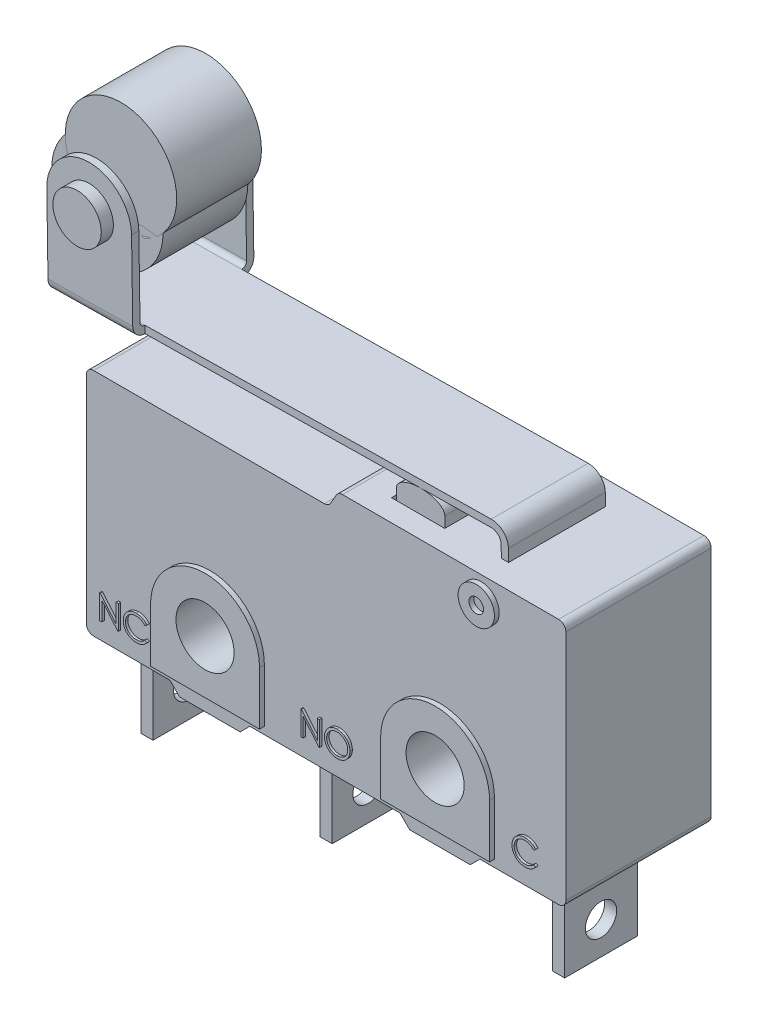
from build123d import *

# Parameters (mm, degrees)
ESQUISSE1_R             = 1.1999999999999995
BOSS_EXTRU_1_DEPTH      = 3
ESQUISSE2_R             = 0.7500000000000004
ESQUISSE2_R_2           = 0.3000000000000001
ESQUISSE2_R_3           = 1.1999999999999995
BOSS_EXTRU_2_DEPTH      = 3.2
ESQUISSE3_W             = 0.38461538461538436
ESQUISSE3_H             = 0.1025641025641022
BOSS_EXTRU_3_DEPTH      = 0.1
ENL_V_MAT_EXTRU_3_DEPTH = 2.1
BOSS_EXTRU_15_DEPTH     = 2
BOSS_EXTRU_16_DEPTH     = 2.5
BOSS_EXTRU_4_DEPTH      = 2
ENL_V_MAT_EXTRU_1_DEPTH = 2.2
ESQUISSE12_R            = 1.0000000000000033
BOSS_EXTRU_17_DEPTH     = 3
ESQUISSE13_R            = 2.2999999999999994
BOSS_EXTRU_18_DEPTH     = 1.75
CONG_1_R                = 0.2
CONG_2_R                = 0.5
BOSS_EXTRU_19_DEPTH     = 1.5
BOSS_EXTRU_19_2_DEPTH   = 1.5
BOSS_EXTRU_19_3_DEPTH   = 1.5
ESQUISSE16_R            = 0.6469837628612904
ENL_V_MAT_EXTRU_2_DEPTH = 26.931303550149586
BOSS_EXTRU_5_DEPTH      = 0.1
BOSS_EXTRU_6_DEPTH      = 0.1
ESQUISSE17_R            = 2.2999999999999994
BOSS_EXTRU_20_DEPTH     = 1.75


with BuildPart() as part:
    # Esquisse1 → Boss.-Extru.1 (new, symmetric)
    with BuildSketch(Plane.XY):
        with BuildLine():
            Line((-7.000000000000008, 3.99e-15), (-9.500000000000009, 3.53e-15))
            Line((-9.500000000000009, 3.53e-15), (-9.900000000000004, 0.39999999999999963))
            Line((-9.900000000000004, 0.39999999999999963), (-13.05, 0.3999999999999993))
            ThreePointArc((-13.05, 0.3999999999999993), (-13.262132034355965, 0.487867965644035), (-13.35, 0.6999999999999993))
            Line((-13.35, 0.6999999999999993), (-13.350000000000001, 9.600000000000003))
            ThreePointArc((-13.350000000000001, 9.600000000000003), (-13.262132034355966, 9.812132034355967), (-13.050000000000002, 9.900000000000002))
            Line((-13.050000000000002, 9.900000000000002), (-3.523205080756888, 9.900000000000002))
            ThreePointArc((-3.523205080756888, 9.900000000000002), (-3.373205080756887, 9.94019237886467), (-3.2633974596215563, 10.050000000000004))
            Line((-3.2633974596215563, 10.050000000000004), (-3.03245735194571, 10.450000000000001))
            ThreePointArc((-3.03245735194571, 10.450000000000001), (-2.9226497308103783, 10.559807621135334), (-2.772649730810377, 10.6))
            Line((-2.772649730810377, 10.6), (6.150000000000001, 10.600000000000001))
            ThreePointArc((6.150000000000001, 10.600000000000001), (6.362132034355965, 10.512132034355966), (6.450000000000002, 10.300000000000002))
            Line((6.450000000000002, 10.300000000000002), (6.450000000000002, 0.7000000000000016))
            ThreePointArc((6.450000000000002, 0.7000000000000016), (6.362132034355966, 0.4878679656440375), (6.150000000000002, 0.4000000000000015))
            Line((6.150000000000002, 0.4000000000000015), (2.9000000000000004, 0.4000000000000011))
            Line((2.9000000000000004, 0.4000000000000011), (2.5000000000000004, -3.8e-16))
            Line((2.5000000000000004, -3.8e-16), (0, 0))
            Line((0, 0), (-0.4000000000000001, 0.40000000000000074))
            Line((-0.4000000000000001, 0.40000000000000074), (-6.599999999999996, 0.4))
            Line((-6.599999999999996, 0.4), (-7.000000000000008, 3.99e-15))
        make_face()
        with Locations((-8.25, 2.9)):
            Circle(ESQUISSE1_R, mode=Mode.SUBTRACT)
        with Locations((1.2499999999999993, 2.9)):
            Circle(ESQUISSE1_R, mode=Mode.SUBTRACT)
    extrude(amount=BOSS_EXTRU_1_DEPTH, both=True)

    # Esquisse2 → Boss.-Extru.2 (add, symmetric)
    # profile 1 of 3: a face of its own
    with BuildSketch(Plane.XY):
        with Locations((2.9500000000000015, 9.600000000000001)):
            Circle(ESQUISSE2_R)
        with Locations((2.9500000000000015, 9.600000000000001)):
            Circle(ESQUISSE2_R_2, mode=Mode.SUBTRACT)
    # profile 2 of 3: a face of its own
    with BuildSketch(Plane.XY):
        with BuildLine():
            Line((-10.499999999999998, 0.6999999999999997), (-6, 0.6999999999999997))
            Line((-6, 0.6999999999999997), (-6, 2.9))
            ThreePointArc((-6, 2.9), (-8.25, 5.15), (-10.5, 2.9))
            Line((-10.5, 2.9), (-10.499999999999998, 0.6999999999999997))
        make_face()
        with Locations((-8.25, 2.9)):
            Circle(ESQUISSE2_R_3, mode=Mode.SUBTRACT)
    # profile 3 of 3: a face of its own
    with BuildSketch(Plane.XY):
        with BuildLine():
            Line((-1.0000000000000013, 2.9), (-1.0000000000000013, 0.6999999999999997))
            Line((-1.0000000000000013, 0.6999999999999997), (3.499999999999998, 0.6999999999999997))
            Line((3.499999999999998, 0.6999999999999997), (3.499999999999998, 2.9))
            ThreePointArc((3.499999999999998, 2.9), (1.2499999999999978, 5.15), (-1.0000000000000013, 2.9))
        make_face()
        with Locations((1.2499999999999976, 2.9)):
            Circle(ESQUISSE2_R_3, mode=Mode.SUBTRACT)
    extrude(amount=BOSS_EXTRU_2_DEPTH, both=True)

    # Esquisse3 → Boss.-Extru.3 (add)
    # profile 1 of 16: a face of its own
    with BuildSketch(Plane(origin=(0, 0, -3), x_dir=(-1, 0, 0), z_dir=(0, 0, -1))):
        with BuildLine():
            Line((-3.3711910034852886, 7.068374541772134), (-3.3711910034852886, 6.965810439208032))
            Line((-3.3711910034852886, 6.965810439208032), (-3.7113352342545194, 6.965810439208032))
            Line((-3.7113352342545194, 6.965810439208032), (-3.7652214522032375, 6.702789605874698))
            add(Edge.make_bspline(
                [(-3.7652214522032375, 6.702789605874698), (-3.7546340595250465, 6.705712540677629), (-3.7341226607157965, 6.711375264566191), (-3.7038484147261608, 6.717662627546043), (-3.675107785163021, 6.72145275441961), (-3.6564576793314476, 6.721970271708806), (-3.6474329906647758, 6.722220695618288)],
                knots=[0, 0, 0, 0, 1.1002734760749815, 2.1316058403597524, 3.0958938383697827, 4, 4, 4, 4], degree=3))
            add(Edge.make_bspline(
                [(-3.6474329906647758, 6.722220695618288), (-3.6362662078898613, 6.721978999705534), (-3.614309522939824, 6.721503765153467), (-3.582184109513073, 6.716940379597952), (-3.5515175685936105, 6.709757546846453), (-3.5223740342575107, 6.699723112064541), (-3.4946995912182888, 6.686891759723301), (-3.4687488593667113, 6.670863205335353), (-3.4441323127990455, 6.652139396435454), (-3.4212915716692827, 6.630612250161277), (-3.4005703407648755, 6.606920359660658), (-3.382351486574309, 6.581446682219663), (-3.366876460773088, 6.554438778752642), (-3.354430530808396, 6.525638604827437), (-3.3444921495866975, 6.495364560995902), (-3.3378772939170376, 6.463298108838117), (-3.3334725199280983, 6.429741503120009), (-3.332980409551074, 6.406797340240815), (-3.33272946502375, 6.395097298182391)],
                knots=[0, 0, 0, 0, 1.052922332971118, 2.070308378688888, 3.0543049701150435, 4.020497102877372, 4.973039431444365, 5.925935799171929, 6.892292201435622, 7.886100009880045, 8.881663170484007, 9.857072815901471, 10.836096530794462, 11.812156883185862, 12.812194150020737, 13.83644130519176, 14.896724719990463, 15.999999999999998, 15.999999999999998, 15.999999999999998, 15.999999999999998], degree=3))
            add(Edge.make_bspline(
                [(-3.33272946502375, 6.395097298182391), (-3.3329194865304275, 6.386948092367545), (-3.333296961567543, 6.370759810203018), (-3.335216558038339, 6.346718610007219), (-3.3389124769138196, 6.3231863719836925), (-3.34387468380069, 6.300159974315491), (-3.3503153746479772, 6.277683010835742), (-3.358112247191499, 6.255691145713806), (-3.3676539693371725, 6.234321258072904), (-3.3781200765540085, 6.213371145208967), (-3.3899047845640986, 6.193314428867619), (-3.4029843580895163, 6.174557575569709), (-3.4168030698673237, 6.156819209432581), (-3.4316720371411185, 6.140289571429959), (-3.447729464316146, 6.125077280603387), (-3.46478088341949, 6.11109205731598), (-3.482690231713526, 6.098097391515094), (-3.501734586662371, 6.086620764322093), (-3.521489581794819, 6.076059919707009), (-3.542240500977813, 6.067396051896911), (-3.5635149868228155, 6.059650186729782), (-3.585619236992768, 6.053476035983612), (-3.6085031834544146, 6.0486381632638055), (-3.632204547877869, 6.045352277377385), (-3.656599025027511, 6.0429590095287455), (-3.6731347429074748, 6.0428091932571375), (-3.681487477844263, 6.042733516131109)],
                knots=[0, 0, 0, 0, 1.0563472938273533, 2.098418968024932, 3.1228415677895556, 4.14128866939639, 5.149314143235321, 6.151154210331126, 7.162517403198004, 8.18037606211429, 9.185164535208633, 10.174177089780748, 11.141909838010019, 12.097768115083088, 13.052685740843792, 14.005601399511681, 14.954263652455996, 15.917497458446022, 16.885230206675274, 17.85450947246843, 18.828990115202213, 19.81800266977433, 20.82617672132415, 21.85788393677542, 22.91794672539547, 23.999999999999996, 23.999999999999996, 23.999999999999996, 23.999999999999996], degree=3))
            add(Edge.make_bspline(
                [(-3.681487477844263, 6.042733516131109), (-3.691451529473466, 6.042930898412298), (-3.711054623960291, 6.04331922473297), (-3.7397747859807375, 6.047381649091279), (-3.7674075304645847, 6.053199910917718), (-3.793730416509561, 6.061953130874391), (-3.818979348996772, 6.072920929357311), (-3.8428144112221583, 6.086782692641718), (-3.8658446329501213, 6.102491007998018), (-3.8871337863071225, 6.121028251702241), (-3.906892675869878, 6.141289875140104), (-3.924580249832832, 6.16327777261603), (-3.940332700329019, 6.186629041783485), (-3.95389777089726, 6.211457085805119), (-3.965468634130517, 6.237696666073015), (-3.9745586307810035, 6.265446094899286), (-3.981895303621894, 6.294560381739114), (-3.9849991380437104, 6.314604241856409), (-3.986575618869904, 6.324784798182391)],
                knots=[0, 0, 0, 0, 1.0467383001422814, 2.0593339501101195, 3.0437782698166163, 4.011590432536625, 4.970194870615103, 5.932262532635629, 6.905835910597633, 7.896367577061666, 8.89413528604054, 9.877477877096155, 10.858688625556418, 11.851381752722359, 12.847765800203907, 13.868841284248289, 14.91755474153421, 16, 16, 16, 16], degree=3))
            Line((-3.986575618869904, 6.324784798182391), (-3.8968320291263145, 6.324784798182391))
            add(Edge.make_bspline(
                [(-3.8968320291263145, 6.324784798182391), (-3.894623869871982, 6.315248668911347), (-3.89037966517459, 6.29691969894793), (-3.8810637369597383, 6.27116788713848), (-3.869673486824675, 6.248219537516764), (-3.8561293872768827, 6.2277710851528925), (-3.839972235709391, 6.2099399430750895), (-3.8215352560120617, 6.194049353950014), (-3.8008644779551406, 6.1797136027135755), (-3.7778949838065987, 6.167764240657201), (-3.75366267542935, 6.157573168257193), (-3.72830061542661, 6.150786969699573), (-3.702499373577727, 6.1460152860302), (-3.685048410664443, 6.145537640086869), (-3.67627914451093, 6.145297618695212)],
                knots=[0, 0, 0, 0, 1.136247022410648, 2.183929868487286, 3.172523383326136, 4.106158343373255, 5.023411330345773, 5.958108904462903, 6.928429099340789, 7.938127109450389, 8.96079060995037, 9.975095811932924, 10.98246739456387, 12, 12, 12, 12], degree=3))
            add(Edge.make_bspline(
                [(-3.67627914451093, 6.145297618695212), (-3.6677195889631333, 6.1455321266680984), (-3.6508657540521114, 6.145993874785542), (-3.6260625007112535, 6.149547878239787), (-3.602115965224928, 6.155021470041962), (-3.579262434722367, 6.1632128571801825), (-3.5571019948397824, 6.173168491016129), (-3.536195203290327, 6.185944226963523), (-3.515937238392993, 6.200647089376381), (-3.496957771672692, 6.21749184081735), (-3.479575071884248, 6.236054610708564), (-3.4642161801316997, 6.255905294544253), (-3.451422776295656, 6.277081536413647), (-3.4406416023328883, 6.2992167229424805), (-3.4324549455264215, 6.322553453564893), (-3.42661466517705, 6.346982360757014), (-3.4231852198003367, 6.3725637836731375), (-3.42271345409406, 6.390012157894913), (-3.42247305476734, 6.39890338792598)],
                knots=[0, 0, 0, 0, 1.0273167245277883, 2.0227950364758875, 3.002884548238771, 3.971462791283416, 4.93288096013782, 5.914575861202308, 6.907176828588507, 7.935150275340233, 8.956128383553937, 9.956726525218546, 10.942570164546778, 11.921478528906006, 12.90784360622869, 13.905385889939256, 14.9326400475968, 16, 16, 16, 16], degree=3))
            add(Edge.make_bspline(
                [(-3.42247305476734, 6.39890338792598), (-3.422661191756326, 6.406925031246322), (-3.4230294431432955, 6.422626256690663), (-3.426038177515569, 6.445597458531017), (-3.4312715981880557, 6.467332613474331), (-3.4385355638871866, 6.487936680323463), (-3.447758280382501, 6.5074290924229015), (-3.4590286553307363, 6.525829966765816), (-3.4725581976003084, 6.542896776258239), (-3.4880130229113564, 6.558637505860954), (-3.504943891752236, 6.573164612967556), (-3.5236421039228447, 6.585548637668113), (-3.5437163687214577, 6.595966899854351), (-3.56492482571256, 6.60495775652371), (-3.587771939594674, 6.611415112352094), (-3.611805263131645, 6.616263079621264), (-3.6372843225450615, 6.61906746895791), (-3.6547045191547625, 6.619456579922412), (-3.6636589522032375, 6.619656593054186)],
                knots=[0, 0, 0, 0, 1.0456221124254999, 2.0466565092898, 3.0137632891472275, 3.9554572362472515, 4.89008206715859, 5.8203174373091, 6.762574622604487, 7.722996705446269, 8.69280353983296, 9.665887285169648, 10.639438260244559, 11.638615905801052, 12.663482002390786, 13.728887083665608, 14.832589033839156, 16, 16, 16, 16], degree=3))
            add(Edge.make_bspline(
                [(-3.6636589522032375, 6.619656593054186), (-3.6714100747193585, 6.619490709866306), (-3.687414176240702, 6.619148203168211), (-3.7119635553062054, 6.616626346932116), (-3.7377611904424137, 6.6125579770955065), (-3.764708189172757, 6.606961906390025), (-3.7928854772021876, 6.599638741601843), (-3.822233591695695, 6.590863169994542), (-3.8528142392954914, 6.580371170362087), (-3.873419303409418, 6.5724476807201775), (-3.8840115163058018, 6.568374541772134)],
                knots=[0, 0, 0, 0, 0.8176242962817476, 1.6881867389910008, 2.600797292521655, 3.5720167770791047, 4.590301741190848, 5.671205678128523, 6.802862970347198, 8, 8, 8, 8], degree=3))
            Line((-3.8840115163058018, 6.568374541772134), (-3.781447413741699, 7.068374541772134))
            Line((-3.781447413741699, 7.068374541772134), (-3.3711910034852886, 7.068374541772134))
        make_face()
    # profile 2 of 16: a face of its own
    with BuildSketch(Plane(origin=(0, 0, -3), x_dir=(-1, 0, 0), z_dir=(0, 0, -1))):
        Polygon((-2.7301653624596476, 7.068374541772134), (-2.268626900921186, 6.068374541772134), (-2.3661829906647758, 6.068374541772134), (-2.514019529126314, 6.3888873622849545), (-2.9673448496391344, 6.3888873622849545), (-3.1193881188699044, 6.068374541772134), (-3.217344849639135, 6.068374541772134), (-2.7429858752801604, 7.068374541772134), align=None)
        Polygon((-2.737577221434006, 6.873462682797776), (-2.9186669650237507, 6.4914514648490576), (-2.5612951701519555, 6.4914514648490576), align=None, mode=Mode.SUBTRACT)
    # profile 3 of 16: a face of its own
    with BuildSketch(Plane(origin=(0, 0, -3), x_dir=(-1, 0, 0), z_dir=(0, 0, -1))):
        Polygon((-1.5817278624596474, 7.068374541772134), (-1.3968320291263139, 7.068374541772134), (-1.3968320291263139, 6.068374541772134), (-1.486575618869904, 6.068374541772134), (-1.486575618869904, 6.965810439208032), (-1.6404217727160577, 6.965810439208032), align=None)
    # profile 4 of 16: a face of its own
    with BuildSketch(Plane(origin=(0, 0, -3), x_dir=(-1, 0, 0), z_dir=(0, 0, -1))):
        with BuildLine():
            Line((-0.896832029126314, 6.760682234079828), (-0.9865756188699036, 6.760682234079828))
            add(Edge.make_bspline(
                [(-0.9865756188699036, 6.760682234079828), (-0.9859907180104952, 6.772588202013484), (-0.9848419882887761, 6.795971206177741), (-0.9794624770711364, 6.8300637508631965), (-0.971765083584031, 6.862650836213157), (-0.9608818110083724, 6.893470811633059), (-0.9473657316455816, 6.922796185127436), (-0.9311571523938983, 6.950510475324947), (-0.9119589093900639, 6.976507957814834), (-0.8901855568056547, 7.0005476273278235), (-0.8665373742185117, 7.022601218984778), (-0.8410213915125007, 7.041645574072254), (-0.8142085265735564, 7.057736337318531), (-0.786180126869158, 7.071188120696773), (-0.7566199658521712, 7.0812852195317815), (-0.7257962921837587, 7.0887771165616655), (-0.6935736817810622, 7.093284643910687), (-0.6716193897676528, 7.093769154083343), (-0.6604538239981089, 7.094015567413161)],
                knots=[0, 0, 0, 0, 1.1006527102498858, 2.161652630898041, 3.183658788970416, 4.1904687964937, 5.175919509887512, 6.163126047456814, 7.151507819852391, 8.156236427250109, 9.156009101557892, 10.134482810578449, 11.092018606748036, 12.04133060457071, 13.00126825845474, 13.972401358723069, 14.968799086320466, 15.999999999999998, 15.999999999999998, 15.999999999999998, 15.999999999999998], degree=3))
            add(Edge.make_bspline(
                [(-0.6604538239981089, 7.094015567413161), (-0.6494886599731539, 7.093758865571609), (-0.6279425043570366, 7.093254455622757), (-0.596496214513355, 7.088922732974976), (-0.5665598446666743, 7.082138278222035), (-0.538191911374702, 7.072619587846809), (-0.511618750068631, 7.059824037163229), (-0.4866407373382462, 7.044453311832329), (-0.46296050568367375, 7.026676217154568), (-0.4416442817944853, 7.005746556169312), (-0.42207054486984125, 6.983403017749209), (-0.40518418625719027, 6.959549331002881), (-0.39072328240766957, 6.934912392227161), (-0.3786696595844743, 6.909304334632444), (-0.3697964770304383, 6.882484040800247), (-0.3630598461649031, 6.854841982859775), (-0.35925201368259146, 6.826092036857899), (-0.3586676069689196, 6.806633020958544), (-0.3583704906647755, 6.796739926387519)],
                knots=[0, 0, 0, 0, 1.1116073639947224, 2.184268761884779, 3.212621177748175, 4.221274765693212, 5.21176036744672, 6.196651075444664, 7.192147500201631, 8.207485112727051, 9.220403447888982, 10.201281604222782, 11.166441694673628, 12.114753414831751, 13.065576455818492, 14.02645073428511, 14.996634278563837, 16, 16, 16, 16], degree=3))
            add(Edge.make_bspline(
                [(-0.3583704906647755, 6.796739926387519), (-0.35885428005234177, 6.782811973651855), (-0.3598133690086761, 6.755200484031705), (-0.3680174765993662, 6.714624808960509), (-0.38083076548378203, 6.675312403507174), (-0.39625858172645145, 6.64367317434019), (-0.4118221371726471, 6.6181778904096085), (-0.42584713934225954, 6.597186831861111), (-0.4422656567770621, 6.57458526946414), (-0.4613166561949725, 6.5504488873572955), (-0.4826060482380405, 6.524588628757707), (-0.5063266663399357, 6.497020115786733), (-0.5326476612031927, 6.468028181552433), (-0.5511215185615757, 6.44822658115591), (-0.5606942086134937, 6.437965887925981)],
                knots=[0, 0, 0, 0, 1.1844263556738217, 2.3480677057279653, 3.509069118095439, 4.696110525597893, 5.3335492880626925, 6.050745305391797, 6.844228055936134, 7.710549037172967, 8.667450064128206, 9.695053472192528, 10.805634455820167, 12, 12, 12, 12], degree=3))
            Line((-0.5606942086134937, 6.437965887925981), (-0.8108945291263139, 6.170938644336237))
            Line((-0.8108945291263139, 6.170938644336237), (-0.3455499778442627, 6.170938644336237))
            Line((-0.3455499778442627, 6.170938644336237), (-0.3455499778442627, 6.068374541772134))
            Line((-0.3455499778442627, 6.068374541772134), (-1.0250371573314425, 6.068374541772134))
            Line((-1.0250371573314425, 6.068374541772134), (-0.6372166445109293, 6.482236721259314))
            add(Edge.make_bspline(
                [(-0.6372166445109293, 6.482236721259314), (-0.6277743911372567, 6.492093380273202), (-0.6096377548175707, 6.51102600501726), (-0.5839855900149412, 6.538666850769837), (-0.5609458790685401, 6.564309576699014), (-0.5403694811337335, 6.587905733397436), (-0.5227027653149271, 6.609800467053299), (-0.5070249847584187, 6.629284668078371), (-0.4944633873349705, 6.6472145110234875), (-0.4808304171384921, 6.667997543569926), (-0.4676264224532858, 6.693372491333941), (-0.4562800350131728, 6.724382116837098), (-0.44936150688499465, 6.756304189030238), (-0.4485315538833302, 6.7778761996151715), (-0.4481140804083652, 6.788727105874699)],
                knots=[0, 0, 0, 0, 1.32963172561582, 2.5539504281732377, 3.673215717877323, 4.687767853392123, 5.6030936323302205, 6.413772471408342, 7.12304329158807, 7.7346840541046005, 8.834405431552456, 9.900288307426358, 10.943827017957098, 12, 12, 12, 12], degree=3))
            add(Edge.make_bspline(
                [(-0.4481140804083652, 6.788727105874699), (-0.4482957210653422, 6.795550362563501), (-0.44865369992008164, 6.808997691238162), (-0.45181304206116796, 6.828713622386337), (-0.45658747237388475, 6.847732140619421), (-0.46342897467329414, 6.86611174608166), (-0.472459471840534, 6.883667646671997), (-0.48345186610270463, 6.900421212444455), (-0.49613474136495184, 6.916618059644477), (-0.5108065326023429, 6.931804716232499), (-0.5269241096899379, 6.9457136320846296), (-0.5439510381428612, 6.958034799345876), (-0.5619653536456923, 6.96833168814554), (-0.580891102838784, 6.976772687339948), (-0.6006755226697429, 6.983394224824616), (-0.6213568784189978, 6.987982390374077), (-0.6428780259282841, 6.990863100073114), (-0.6575733104113238, 6.9912528634755065), (-0.6650611957929806, 6.9914514648490576)],
                knots=[0, 0, 0, 0, 0.9914464109929845, 1.9539504902127267, 2.8958159495974547, 3.8389314632304177, 4.798493297704389, 5.759821559631791, 6.74841186786633, 7.785213222738008, 8.824556873915855, 9.840280684159671, 10.836137866586514, 11.835679397803412, 12.848801642607217, 13.863922112251181, 14.91157558683439, 16, 16, 16, 16], degree=3))
            add(Edge.make_bspline(
                [(-0.6650611957929806, 6.9914514648490576), (-0.6728814337233592, 6.991247169916506), (-0.6882390897860904, 6.990845968400973), (-0.7107873849108161, 6.988039492974681), (-0.732297607060491, 6.9831978242898405), (-0.7528238650470388, 6.976575917322122), (-0.7724008895649606, 6.968159189087171), (-0.7909334735756248, 6.957675833464666), (-0.8083800133641723, 6.945166263992512), (-0.8247733057485994, 6.9309832478999285), (-0.8398772997667546, 6.915192504695376), (-0.8531478357281596, 6.89758965810482), (-0.8647432683406263, 6.878496110855937), (-0.8748601921919972, 6.857963382121837), (-0.8830761036442171, 6.835805159269119), (-0.8893541466245316, 6.812100100740992), (-0.8943218171164211, 6.786951134615692), (-0.8959813944320926, 6.769583967513815), (-0.896832029126314, 6.760682234079828)],
                knots=[0, 0, 0, 0, 1.0310187455238864, 2.0247505803468515, 2.99019445498514, 3.9340405694313016, 4.864654155060279, 5.7950594891625755, 6.735614924666334, 7.690564532474664, 8.649604399260141, 9.611025573591272, 10.59097263611516, 11.591080094623736, 12.624614302107895, 13.701020112815922, 14.821632451293825, 16, 16, 16, 16], degree=3))
        make_face()
    # profile 5 of 16: a face of its own
    with BuildSketch(Plane(origin=(0, 0, -3), x_dir=(-1, 0, 0), z_dir=(0, 0, -1))):
        with BuildLine():
            Line((0.3723987401044555, 7.068374541772134), (0.3723987401044555, 6.965810439208032))
            Line((0.3723987401044555, 6.965810439208032), (0.03225450933522483, 6.965810439208032))
            Line((0.03225450933522483, 6.965810439208032), (-0.02163170861349366, 6.702789605874698))
            add(Edge.make_bspline(
                [(-0.02163170861349366, 6.702789605874698), (-0.01104431593530271, 6.705712540677629), (0.00946708287394745, 6.711375264566191), (0.03974132886358294, 6.717662627546043), (0.06848195842672278, 6.72145275441961), (0.08713206425829612, 6.721970271708806), (0.09615675292496806, 6.722220695618288)],
                knots=[0, 0, 0, 0, 1.1002734760749815, 2.1316058403597524, 3.095893838369768, 4, 4, 4, 4], degree=3))
            add(Edge.make_bspline(
                [(0.09615675292496806, 6.722220695618288), (0.10732353569988283, 6.721978999705534), (0.12928022064991998, 6.721503765153467), (0.1614056340766711, 6.716940379597953), (0.19207217499613344, 6.709757546846453), (0.22121570933223295, 6.69972311206454), (0.24889015237145556, 6.686891759723301), (0.2748408842230328, 6.670863205335353), (0.2994574307906987, 6.652139396435455), (0.3222981719204617, 6.630612250161277), (0.343019402824868, 6.606920359660658), (0.36123825701543516, 6.581446682219663), (0.3767132828166554, 6.554438778752641), (0.38915921278134824, 6.525638604827437), (0.39909759400304634, 6.495364560995902), (0.40571244967270575, 6.463298108838117), (0.4101172236616454, 6.429741503120009), (0.4106093340386696, 6.406797340240815), (0.41086027856599394, 6.395097298182391)],
                knots=[0, 0, 0, 0, 1.0529223329711177, 2.0703083786889014, 3.0543049701150444, 4.020497102877372, 4.973039431444378, 5.925935799171918, 6.892292201435633, 7.886100009880046, 8.881663170484007, 9.85707281590148, 10.836096530794464, 11.81215688318587, 12.81219415002074, 13.836441305191764, 14.896724719990466, 16, 16, 16, 16], degree=3))
            add(Edge.make_bspline(
                [(0.41086027856599394, 6.395097298182391), (0.4106702570593164, 6.386948092367545), (0.41029278202220043, 6.370759810203018), (0.4083731855514051, 6.346718610007219), (0.40467726667592424, 6.3231863719836925), (0.39971505978905386, 6.300159974315491), (0.3932743689417666, 6.277683010835742), (0.38547749639824486, 6.255691145713806), (0.37593577425257146, 6.234321258072904), (0.3654696670357359, 6.213371145208967), (0.3536849590256457, 6.193314428867619), (0.3406053855002275, 6.174557575569709), (0.32678667372242026, 6.156819209432581), (0.3119177064486257, 6.140289571429957), (0.2958602792735983, 6.125077280603387), (0.2788088601702534, 6.11109205731598), (0.2608995118762177, 6.098097391515094), (0.24185515692737267, 6.086620764322093), (0.22210016179492492, 6.076059919707009), (0.2013492426119301, 6.067396051896911), (0.18007475676692816, 6.059650186729782), (0.15797050659697598, 6.053476035983612), (0.1350865601353295, 6.0486381632638055), (0.11138519571187509, 6.045352277377385), (0.08699071856223244, 6.0429590095287455), (0.07045500068226905, 6.0428091932571375), (0.06210226574548082, 6.042733516131109)],
                knots=[0, 0, 0, 0, 1.0563472938273533, 2.098418968024932, 3.1228415677895556, 4.14128866939639, 5.149314143235321, 6.151154210331126, 7.162517403197997, 8.180376062114282, 9.185164535208635, 10.17417708978075, 11.14190983801002, 12.097768115083076, 13.052685740843796, 14.005601399511683, 14.954263652455998, 15.917497458446025, 16.885230206675296, 17.854509472468447, 18.828990115202235, 19.81800266977433, 20.82617672132415, 21.85788393677544, 22.91794672539547, 23.999999999999996, 23.999999999999996, 23.999999999999996, 23.999999999999996], degree=3))
            add(Edge.make_bspline(
                [(0.06210226574548082, 6.042733516131109), (0.0521382141162782, 6.042930898412298), (0.03253511962945363, 6.04331922473297), (0.00381495760900661, 6.047381649091279), (-0.02381778687484, 6.053199910917718), (-0.05014067291981742, 6.061953130874391), (-0.07538960540702858, 6.072920929357311), (-0.09922466763241394, 6.086782692641718), (-0.12225488936037744, 6.102491007998018), (-0.14354404271737853, 6.121028251702241), (-0.1633029322801349, 6.141289875140102), (-0.18099050624308707, 6.16327777261603), (-0.1967429567392746, 6.186629041783485), (-0.21030802730751602, 6.211457085805119), (-0.22187889054077137, 6.237696666073015), (-0.23096888719125866, 6.265446094899286), (-0.23830556003215086, 6.294560381739114), (-0.2414093944539668, 6.314604241856409), (-0.24298587528016025, 6.324784798182391)],
                knots=[0, 0, 0, 0, 1.046738300142266, 2.059333950110119, 3.0437782698166154, 4.011590432536624, 4.970194870615102, 5.932262532635628, 6.905835910597632, 7.896367577061664, 8.894135286040548, 9.877477877096146, 10.85868862555641, 11.851381752722357, 12.8477658002039, 13.868841284248285, 14.917554741534211, 15.999999999999998, 15.999999999999998, 15.999999999999998, 15.999999999999998], degree=3))
            Line((-0.24298587528016025, 6.324784798182391), (-0.15324228553657057, 6.324784798182391))
            add(Edge.make_bspline(
                [(-0.15324228553657057, 6.324784798182391), (-0.15103412628223808, 6.315248668911347), (-0.14678992158484577, 6.29691969894793), (-0.13747399336999394, 6.27116788713848), (-0.12608374323493157, 6.248219537516764), (-0.1125396436871388, 6.2277710851528925), (-0.09638249211964729, 6.2099399430750895), (-0.07794551242231819, 6.194049353950014), (-0.05727473436539646, 6.1797136027135755), (-0.03430524021685466, 6.167764240657201), (-0.01007293183960614, 6.157573168257193), (0.01528912816313358, 6.150786969699573), (0.04109037001201634, 6.1460152860302), (0.05854133292530109, 6.145537640086869), (0.06731059907881445, 6.145297618695212)],
                knots=[0, 0, 0, 0, 1.1362470224106467, 2.183929868487283, 3.1725233833261317, 4.10615834337325, 5.023411330345767, 5.958108904462895, 6.92842909934078, 7.938127109450378, 8.96079060995036, 9.975095811932912, 10.982467394563855, 12, 12, 12, 12], degree=3))
            add(Edge.make_bspline(
                [(0.06731059907881445, 6.145297618695212), (0.07587015462661088, 6.1455321266680984), (0.09272398953763228, 6.145993874785542), (0.11752724287849041, 6.149547878239787), (0.1414737783648157, 6.155021470041962), (0.16432730886737723, 6.1632128571801825), (0.18648774874996135, 6.173168491016129), (0.2073945402994171, 6.185944226963523), (0.22765250519675054, 6.200647089376382), (0.24663197191705236, 6.21749184081735), (0.26401467170549503, 6.236054610708564), (0.2793735634580439, 6.255905294544253), (0.29216696729408737, 6.277081536413647), (0.3029481412568553, 6.2992167229424805), (0.3111347980633214, 6.322553453564893), (0.3169750784126942, 6.346982360757014), (0.3204045237894069, 6.3725637836731375), (0.32087628949568403, 6.390012157894913), (0.32111668882240424, 6.39890338792598)],
                knots=[0, 0, 0, 0, 1.027316724527772, 2.0227950364758893, 3.0028845482387574, 3.971462791283403, 4.932880960137808, 5.914575861202297, 6.907176828588497, 7.935150275340237, 8.956128383553919, 9.956726525218537, 10.94257016454677, 11.921478528905999, 12.90784360622868, 13.90538588993925, 14.932640047596797, 16, 16, 16, 16], degree=3))
            add(Edge.make_bspline(
                [(0.32111668882240424, 6.39890338792598), (0.32092855183341784, 6.406925031246322), (0.32056030044644773, 6.422626256690663), (0.31755156607417523, 6.445597458531017), (0.3123181454016888, 6.467332613474331), (0.30505417970255694, 6.487936680323463), (0.29583146320724335, 6.5074290924229015), (0.2845610882590075, 6.525829966765816), (0.2710315459894358, 6.542896776258239), (0.2555767206783877, 6.558637505860954), (0.23864585183750803, 6.573164612967556), (0.2199476396668993, 6.5855486376681105), (0.19987337486828624, 6.595966899854351), (0.17866491787718414, 6.60495775652371), (0.15581780399506967, 6.611415112352094), (0.13178448045809865, 6.616263079621264), (0.1063054210446826, 6.61906746895791), (0.08888522443498138, 6.619456579922412), (0.07993079138650644, 6.619656593054186)],
                knots=[0, 0, 0, 0, 1.0456221124255014, 2.0466565092897993, 3.013763289147226, 3.95545723624725, 4.8900820671585805, 5.820317437309102, 6.762574622604489, 7.722996705446283, 8.69280353983296, 9.665887285169662, 10.639438260244559, 11.638615905801052, 12.663482002390769, 13.728887083665589, 14.832589033839156, 16, 16, 16, 16], degree=3))
            add(Edge.make_bspline(
                [(0.07993079138650644, 6.619656593054186), (0.07217966887038532, 6.619490709866306), (0.05617556734904172, 6.619148203168211), (0.03162618828353807, 6.616626346932116), (0.00582855314733021, 6.6125579770955065), (-0.02111844558301279, 6.606961906390025), (-0.04929573361244362, 6.599638741601843), (-0.07864384810595086, 6.590863169994542), (-0.10922449570574772, 6.580371170362087), (-0.12982955981967423, 6.5724476807201775), (-0.14042177271605777, 6.568374541772134)],
                knots=[0, 0, 0, 0, 0.8176242962817476, 1.6881867389910008, 2.600797292521655, 3.57201677707912, 4.590301741190833, 5.671205678128537, 6.8028629703471974, 8, 8, 8, 8], degree=3))
            Line((-0.14042177271605777, 6.568374541772134), (-0.03785767015195528, 7.068374541772134))
            Line((-0.03785767015195528, 7.068374541772134), (0.3723987401044555, 7.068374541772134))
        make_face()
    # profile 6 of 16: a face of its own
    with BuildSketch(Plane(origin=(0, 0, -3), x_dir=(-1, 0, 0), z_dir=(0, 0, -1))):
        with Locations((0.7057320734377885, 6.452989926387518)):
            Rectangle(ESQUISSE3_W, ESQUISSE3_H)
    # profile 7 of 16: a face of its own
    with BuildSketch(Plane(origin=(0, 0, -3), x_dir=(-1, 0, 0), z_dir=(0, 0, -1))):
        with BuildLine():
            Line((1.1031679708736857, 6.760682234079828), (1.013424381130096, 6.760682234079828))
            add(Edge.make_bspline(
                [(1.013424381130096, 6.760682234079828), (1.0140092819895046, 6.772588202013484), (1.0151580117112242, 6.795971206177741), (1.0205375229288638, 6.8300637508631965), (1.0282349164159694, 6.862650836213157), (1.0391181889916277, 6.893470811633059), (1.052634268354418, 6.922796185127436), (1.0688428476061014, 6.950510475324947), (1.0880410906099363, 6.976507957814834), (1.1098144431943453, 7.0005476273278235), (1.1334626257814884, 7.022601218984778), (1.1589786084874998, 7.041645574072254), (1.1857914734264443, 7.057736337318531), (1.2138198731308425, 7.071188120696773), (1.2433800341478287, 7.0812852195317815), (1.2742037078162414, 7.0887771165616655), (1.3064263182189377, 7.093284643910687), (1.3283806102323479, 7.093769154083343), (1.3395461760018914, 7.094015567413161)],
                knots=[0, 0, 0, 0, 1.1006527102498862, 2.161652630898043, 3.1836587889704173, 4.190468796493696, 5.175919509887509, 6.163126047456808, 7.1515078198523865, 8.156236427250105, 9.156009101557887, 10.134482810578454, 11.092018606748042, 12.041330604570716, 13.00126825845473, 13.972401358723058, 14.96879908632047, 16, 16, 16, 16], degree=3))
            add(Edge.make_bspline(
                [(1.3395461760018914, 7.094015567413161), (1.3505113400268467, 7.093758865571609), (1.3720574956429636, 7.093254455622757), (1.4035037854866452, 7.088922732974976), (1.4334401553333258, 7.082138278222035), (1.4618080886252982, 7.072619587846809), (1.4883812499313689, 7.059824037163229), (1.5133592626617542, 7.044453311832329), (1.5370394943163264, 7.026676217154568), (1.558355718205515, 7.005746556169312), (1.5779294551301597, 6.983403017749209), (1.594815813742809, 6.959549331002881), (1.6092767175923315, 6.934912392227162), (1.6213303404155246, 6.909304334632444), (1.6302035229695624, 6.882484040800247), (1.636940153835096, 6.854841982859775), (1.64074798631741, 6.826092036857901), (1.6413323930310806, 6.806633020958544), (1.6416295093352244, 6.796739926387519)],
                knots=[0, 0, 0, 0, 1.1116073639947235, 2.1842687618847663, 3.212621177748163, 4.221274765693215, 5.2117603674467095, 6.196651075444667, 7.192147500201634, 8.207485112727056, 9.220403447888987, 10.201281604222771, 11.166441694673633, 12.114753414831746, 13.06557645581849, 14.026450734285104, 14.996634278563837, 16, 16, 16, 16], degree=3))
            add(Edge.make_bspline(
                [(1.6416295093352244, 6.796739926387519), (1.6411457199476585, 6.782811973651855), (1.6401866309913244, 6.755200484031705), (1.6319825234006344, 6.714624808960509), (1.6191692345162187, 6.675312403507174), (1.603741418273548, 6.64367317434019), (1.588177862827353, 6.6181778904096085), (1.5741528606577402, 6.597186831861111), (1.5577343432229385, 6.57458526946414), (1.5386833438050278, 6.5504488873572955), (1.5173939517619595, 6.524588628757707), (1.4936733336600638, 6.497020115786733), (1.4673523387968068, 6.468028181552434), (1.4488784814384246, 6.44822658115591), (1.4393057913865068, 6.437965887925981)],
                knots=[0, 0, 0, 0, 1.1844263556738213, 2.3480677057279653, 3.509069118095438, 4.696110525597904, 5.333549288062697, 6.0507453053918026, 6.844228055936132, 7.710549037172966, 8.667450064128213, 9.695053472192544, 10.805634455820183, 12, 12, 12, 12], degree=3))
            Line((1.4393057913865068, 6.437965887925981), (1.1891054708736857, 6.170938644336237))
            Line((1.1891054708736857, 6.170938644336237), (1.6544500221557374, 6.170938644336237))
            Line((1.6544500221557374, 6.170938644336237), (1.6544500221557374, 6.068374541772134))
            Line((1.6544500221557374, 6.068374541772134), (0.9749628426685576, 6.068374541772134))
            Line((0.9749628426685576, 6.068374541772134), (1.3627833554890707, 6.482236721259314))
            add(Edge.make_bspline(
                [(1.3627833554890707, 6.482236721259314), (1.3722256088627431, 6.492093380273202), (1.39036224518243, 6.51102600501726), (1.416014409985058, 6.538666850769837), (1.43905412093146, 6.564309576699014), (1.4596305188662664, 6.587905733397438), (1.4772972346850721, 6.609800467053299), (1.492975015241582, 6.629284668078371), (1.5055366126650291, 6.647214511023489), (1.519169582861508, 6.667997543569926), (1.5323735775467147, 6.693372491333941), (1.5437199649868274, 6.724382116837098), (1.5506384931150055, 6.756304189030238), (1.5514684461166697, 6.7778761996151715), (1.5518859195916348, 6.788727105874699)],
                knots=[0, 0, 0, 0, 1.3296317256158194, 2.5539504281732266, 3.673215717877321, 4.687767853392111, 5.603093632330209, 6.413772471408347, 7.123043291588067, 7.734684054104597, 8.834405431552458, 9.90028830742636, 10.943827017957098, 12, 12, 12, 12], degree=3))
            add(Edge.make_bspline(
                [(1.5518859195916348, 6.788727105874699), (1.551704278934658, 6.795550362563501), (1.5513463000799192, 6.808997691238162), (1.5481869579388317, 6.828713622386337), (1.543412527626116, 6.847732140619421), (1.5365710253267055, 6.86611174608166), (1.5275405281594658, 6.883667646671997), (1.516548133897296, 6.900421212444455), (1.503865258635048, 6.916618059644477), (1.489193467397658, 6.931804716232499), (1.4730758903100625, 6.9457136320846296), (1.4560489618571388, 6.958034799345876), (1.4380346463543074, 6.96833168814554), (1.419108897161216, 6.976772687339948), (1.3993244773302573, 6.983394224824616), (1.3786431215810029, 6.987982390374077), (1.3571219740717162, 6.990863100073116), (1.3424266895886763, 6.9912528634755065), (1.3349388042070194, 6.9914514648490576)],
                knots=[0, 0, 0, 0, 0.9914464109929825, 1.9539504902127267, 2.895815949597449, 3.838931463230419, 4.798493297704389, 5.759821559631779, 6.74841186786633, 7.785213222737993, 8.824556873915839, 9.840280684159671, 10.836137866586515, 11.835679397803412, 12.848801642607198, 13.863922112251181, 14.911575586834369, 16, 16, 16, 16], degree=3))
            add(Edge.make_bspline(
                [(1.3349388042070194, 6.9914514648490576), (1.327118566276641, 6.991247169916506), (1.3117609102139096, 6.990845968400973), (1.289212615089184, 6.988039492974681), (1.2677023929395093, 6.9831978242898405), (1.247176134952961, 6.976575917322122), (1.2275991104350394, 6.968159189087171), (1.2090665264243752, 6.957675833464666), (1.1916199866358277, 6.945166263992512), (1.1752266942514011, 6.930983247899928), (1.1601227002332462, 6.915192504695376), (1.14685216427184, 6.89758965810482), (1.1352567316593736, 6.878496110855937), (1.1251398078080026, 6.857963382121837), (1.1169238963557833, 6.835805159269119), (1.110645853375468, 6.812100100740992), (1.1056781828835793, 6.786951134615693), (1.1040186055679073, 6.769583967513814), (1.1031679708736857, 6.760682234079828)],
                knots=[0, 0, 0, 0, 1.0310187455238862, 2.024750580346851, 2.9901944549851214, 3.934040569431301, 4.864654155060278, 5.795059489162575, 6.735614924666333, 7.6905645324746486, 8.649604399260125, 9.611025573591279, 10.590972636115156, 11.591080094623734, 12.624614302107894, 13.701020112815923, 14.821632451293823, 16, 16, 16, 16], degree=3))
        make_face()
    # profile 8 of 16: a face of its own
    with BuildSketch(Plane(origin=(0, 0, -3), x_dir=(-1, 0, 0), z_dir=(0, 0, -1))):
        with BuildLine():
            Line((2.3723987401044555, 7.068374541772134), (2.3723987401044555, 6.965810439208032))
            Line((2.3723987401044555, 6.965810439208032), (2.0322545093352247, 6.965810439208032))
            Line((2.0322545093352247, 6.965810439208032), (1.9783682913865064, 6.702789605874698))
            add(Edge.make_bspline(
                [(1.9783682913865064, 6.702789605874698), (1.9889556840646974, 6.705712540677629), (2.009467082873947, 6.711375264566191), (2.0397413288635833, 6.717662627546043), (2.068481958426723, 6.72145275441961), (2.0871320642582964, 6.721970271708806), (2.0961567529249683, 6.722220695618288)],
                knots=[0, 0, 0, 0, 1.1002734760749815, 2.1316058403597524, 3.095893838369797, 4, 4, 4, 4], degree=3))
            add(Edge.make_bspline(
                [(2.0961567529249683, 6.722220695618288), (2.1073235356998827, 6.721978999705534), (2.1292802206499197, 6.721503765153467), (2.161405634076671, 6.716940379597953), (2.1920721749961336, 6.709757546846453), (2.221215709332233, 6.69972311206454), (2.2488901523714557, 6.686891759723301), (2.2748408842230328, 6.670863205335353), (2.299457430790699, 6.652139396435455), (2.3222981719204614, 6.630612250161277), (2.343019402824868, 6.606920359660658), (2.3612382570154344, 6.581446682219663), (2.3767132828166555, 6.554438778752641), (2.389159212781349, 6.525638604827437), (2.3990975940030466, 6.495364560995902), (2.405712449672706, 6.463298108838117), (2.4101172236616453, 6.429741503120009), (2.4106093340386696, 6.406797340240815), (2.410860278565994, 6.395097298182391)],
                knots=[0, 0, 0, 0, 1.0529223329711177, 2.0703083786889014, 3.0543049701150444, 4.020497102877372, 4.973039431444378, 5.925935799171918, 6.892292201435633, 7.886100009880046, 8.881663170484007, 9.85707281590148, 10.836096530794464, 11.81215688318587, 12.81219415002074, 13.836441305191764, 14.896724719990466, 16, 16, 16, 16], degree=3))
            add(Edge.make_bspline(
                [(2.410860278565994, 6.395097298182391), (2.410670257059316, 6.386948092367545), (2.4102927820222004, 6.370759810203018), (2.408373185551405, 6.346718610007219), (2.4046772666759244, 6.3231863719836925), (2.399715059789054, 6.300159974315491), (2.393274368941767, 6.277683010835742), (2.385477496398245, 6.255691145713806), (2.375935774252572, 6.234321258072904), (2.3654696670357365, 6.213371145208967), (2.3536849590256455, 6.193314428867619), (2.340605385500228, 6.174557575569709), (2.3267866737224208, 6.156819209432581), (2.311917706448626, 6.140289571429957), (2.295860279273598, 6.125077280603387), (2.278808860170254, 6.111092057315978), (2.2608995118762185, 6.098097391515094), (2.241855156927373, 6.0866207643220935), (2.222100161794925, 6.076059919707009), (2.201349242611931, 6.067396051896911), (2.1800747567669294, 6.059650186729782), (2.157970506596976, 6.053476035983612), (2.1350865601353295, 6.0486381632638055), (2.1113851957118754, 6.045352277377385), (2.086990718562232, 6.0429590095287455), (2.070455000682269, 6.0428091932571375), (2.062102265745481, 6.042733516131109)],
                knots=[0, 0, 0, 0, 1.056347293827353, 2.0984189680249314, 3.122841567789555, 4.141288669396389, 5.14931414323532, 6.151154210331125, 7.162517403197996, 8.180376062114282, 9.185164535208635, 10.174177089780748, 11.141909838010019, 12.097768115083074, 13.052685740843792, 14.005601399511681, 14.954263652455996, 15.917497458446022, 16.885230206675256, 17.85450947246841, 18.828990115202195, 19.81800266977433, 20.82617672132415, 21.85788393677544, 22.917946725395474, 24, 24, 24, 24], degree=3))
            add(Edge.make_bspline(
                [(2.062102265745481, 6.042733516131109), (2.0521382141162783, 6.042930898412298), (2.0325351196294537, 6.04331922473297), (2.003814957609007, 6.047381649091279), (1.9761822131251594, 6.053199910917718), (1.9498593270801827, 6.061953130874391), (1.9246103945929716, 6.072920929357311), (1.900775332367586, 6.086782692641718), (1.8777451106396226, 6.102491007998018), (1.8564559572826216, 6.121028251702241), (1.8366970677198657, 6.141289875140104), (1.8190094937569126, 6.16327777261603), (1.8032570432607253, 6.186629041783485), (1.7896919726924843, 6.211457085805119), (1.778121109459228, 6.237696666073015), (1.7690311128087415, 6.265446094899286), (1.7616944399678498, 6.294560381739114), (1.7585906055460334, 6.314604241856409), (1.7570141247198399, 6.324784798182391)],
                knots=[0, 0, 0, 0, 1.0467383001422663, 2.0593339501101195, 3.0437782698166163, 4.011590432536625, 4.970194870615103, 5.932262532635629, 6.905835910597633, 7.896367577061666, 8.89413528604054, 9.877477877096155, 10.858688625556418, 11.851381752722359, 12.847765800203907, 13.868841284248289, 14.91755474153421, 16, 16, 16, 16], degree=3))
            Line((1.7570141247198399, 6.324784798182391), (1.8467577144634295, 6.324784798182391))
            add(Edge.make_bspline(
                [(1.8467577144634295, 6.324784798182391), (1.8489658737177619, 6.315248668911347), (1.8532100784151542, 6.296919698947929), (1.8625260066300071, 6.271167887138481), (1.8739162567650687, 6.248219537516764), (1.8874603563128614, 6.2277710851528925), (1.9036175078803528, 6.2099399430750895), (1.922054487577682, 6.194049353950014), (1.9427252656346037, 6.1797136027135755), (1.9656947597831453, 6.167764240657201), (1.9899270681603938, 6.157573168257193), (2.0152891281631335, 6.150786969699573), (2.041090370012016, 6.1460152860302), (2.058541332925301, 6.145537640086869), (2.0673105990788145, 6.145297618695212)],
                knots=[0, 0, 0, 0, 1.136247022410647, 2.1839298684872888, 3.1725233833261304, 4.106158343373248, 5.023411330345766, 5.958108904462894, 6.9284290993407796, 7.938127109450377, 8.96079060995036, 9.975095811932912, 10.982467394563855, 12.000000000000002, 12.000000000000002, 12.000000000000002, 12.000000000000002], degree=3))
            add(Edge.make_bspline(
                [(2.0673105990788145, 6.145297618695212), (2.075870154626611, 6.1455321266680984), (2.0927239895376317, 6.145993874785542), (2.1175272428784906, 6.149547878239787), (2.1414737783648157, 6.155021470041962), (2.164327308867377, 6.1632128571801825), (2.1864877487499617, 6.173168491016129), (2.207394540299417, 6.185944226963523), (2.227652505196751, 6.200647089376382), (2.2466319719170524, 6.21749184081735), (2.264014671705496, 6.236054610708564), (2.279373563458044, 6.255905294544253), (2.2921669672940874, 6.277081536413647), (2.3029481412568553, 6.2992167229424805), (2.3111347980633212, 6.322553453564893), (2.3169750784126935, 6.346982360757014), (2.3204045237894073, 6.3725637836731375), (2.320876289495684, 6.390012157894913), (2.3211166888224044, 6.39890338792598)],
                knots=[0, 0, 0, 0, 1.0273167245277717, 2.022795036475889, 3.002884548238757, 3.971462791283402, 4.932880960137807, 5.914575861202296, 6.907176828588495, 7.935150275340236, 8.95612838355394, 9.95672652521854, 10.942570164546773, 11.921478528906002, 12.907843606228681, 13.905385889939252, 14.932640047596799, 16, 16, 16, 16], degree=3))
            add(Edge.make_bspline(
                [(2.3211166888224044, 6.39890338792598), (2.3209285518334184, 6.406925031246322), (2.320560300446449, 6.422626256690663), (2.3175515660741746, 6.445597458531017), (2.312318145401689, 6.467332613474331), (2.305054179702557, 6.487936680323463), (2.2958314632072434, 6.5074290924229015), (2.284561088259008, 6.525829966765816), (2.2710315459894357, 6.542896776258238), (2.2555767206783885, 6.558637505860954), (2.238645851837508, 6.573164612967556), (2.2199476396669, 6.585548637668113), (2.1998733748682864, 6.595966899854351), (2.178664917877185, 6.60495775652371), (2.15581780399507, 6.611415112352094), (2.1317844804580983, 6.616263079621264), (2.106305421044683, 6.61906746895791), (2.0888852244349816, 6.619456579922412), (2.0799307913865066, 6.619656593054186)],
                knots=[0, 0, 0, 0, 1.0456221124254992, 2.0466565092898015, 3.0137632891472275, 3.955457236247251, 4.890082067158581, 5.820317437309101, 6.762574622604487, 7.722996705446255, 8.69280353983296, 9.665887285169632, 10.63943826024456, 11.638615905801053, 12.663482002390769, 13.728887083665589, 14.832589033839156, 15.999999999999998, 15.999999999999998, 15.999999999999998, 15.999999999999998], degree=3))
            add(Edge.make_bspline(
                [(2.0799307913865066, 6.619656593054186), (2.072179668870385, 6.619490709866306), (2.0561755673490416, 6.619148203168211), (2.0316261882835382, 6.616626346932116), (2.0058285531473308, 6.6125579770955065), (1.978881554416987, 6.606961906390025), (1.9507042663875571, 6.599638741601843), (1.9213561518940496, 6.590863169994542), (1.8907755042942525, 6.580371170362087), (1.8701704401803259, 6.5724476807201775), (1.8595782272839423, 6.568374541772134)],
                knots=[0, 0, 0, 0, 0.8176242962817478, 1.6881867389910012, 2.6007972925216554, 3.572016777079091, 4.590301741190834, 5.6712056781285085, 6.802862970347198, 8, 8, 8, 8], degree=3))
            Line((1.8595782272839423, 6.568374541772134), (1.9621423298480447, 7.068374541772134))
            Line((1.9621423298480447, 7.068374541772134), (2.3723987401044555, 7.068374541772134))
        make_face()
    # profile 9 of 16: a face of its own
    with BuildSketch(Plane(origin=(0, 0, -3), x_dir=(-1, 0, 0), z_dir=(0, 0, -1))):
        with BuildLine():
            add(Edge.make_bspline(
                [(2.5134243811300965, 6.567973900746494), (2.5135181006036578, 6.584001725813422), (2.5137001520319, 6.615136007026984), (2.5157254151582533, 6.6605030476175), (2.519089798676304, 6.703063130187548), (2.5237004766335254, 6.742818291912813), (2.529311328125982, 6.77977879606073), (2.5368014671549273, 6.813845869528246), (2.545319410759203, 6.845177185703405), (2.5551915381336325, 6.87387491383941), (2.5663309064245863, 6.900325686131458), (2.578454980916607, 6.925018600786818), (2.592044922180485, 6.947916295741042), (2.6063240401596586, 6.969384235861024), (2.621870346339034, 6.989071005801693), (2.638241429329676, 7.007254623664128), (2.6560762511202842, 7.0235148380823595), (2.6747685391984115, 7.038328067335237), (2.694487529024616, 7.051313630670078), (2.7146711479226746, 7.062751555988869), (2.7354583210243706, 7.072522946633897), (2.756905801852351, 7.080205928308053), (2.778820818392261, 7.0865518845288), (2.801279980304059, 7.09089158385639), (2.8243203700001516, 7.0936221291390735), (2.8398722085139076, 7.093883177064844), (2.8477593170275326, 7.094015567413161)],
                knots=[0, 0, 0, 0, 1.6462709342098236, 3.19790501863923, 4.6635020752381395, 6.030701354807183, 7.30832254215232, 8.50163775967979, 9.61153413057573, 10.641858118523796, 11.61635684679227, 12.558055218556877, 13.465016945480633, 14.34960574474561, 15.204443732548679, 16.039544428071636, 16.859896110873155, 17.680448484322984, 18.487036064658927, 19.282494120461983, 20.061910839984684, 20.84304589894296, 21.620316917836366, 22.403196591136975, 23.190181807154943, 24, 24, 24, 24], degree=3))
            add(Edge.make_bspline(
                [(2.8477593170275326, 7.094015567413161), (2.8557123108802016, 7.093876191648684), (2.871528313421826, 7.093599017104605), (2.8949112777778017, 7.090935033523288), (2.9177540439819722, 7.086514712638451), (2.939959226468681, 7.080251577043404), (2.961709222602332, 7.072481383712141), (2.98283391050109, 7.062742207395235), (3.0034645052559594, 7.051405388153959), (3.023273158833075, 7.0380842803520665), (3.0424773346462395, 7.023232201438705), (3.060605324066839, 7.0064428674948935), (3.0776587771803983, 6.987885804846705), (3.0938517215764643, 6.96775955802196), (3.108724749347678, 6.945678105212365), (3.1228885871292302, 6.922025502408324), (3.1355663116725627, 6.896388112467237), (3.147776218866447, 6.869193693084081), (3.1583153579348022, 6.83968979056789), (3.167819999441178, 6.808042716134151), (3.1754997047483022, 6.77387866274748), (3.1818966397020545, 6.737376878377449), (3.1868523242579436, 6.698403311737405), (3.1904616505661023, 6.657041507305474), (3.192368246292198, 6.613264252836683), (3.1927273037798183, 6.583333438786065), (3.192911560617276, 6.567973900746494)],
                knots=[0, 0, 0, 0, 0.8109147879050413, 1.6126543769731163, 2.396697860563787, 3.1815986910301794, 3.963628158114876, 4.749916496538996, 5.551656085607075, 6.361998678416937, 7.182127410194746, 8.025565596119476, 8.878627764223387, 9.750805456801457, 10.65753167276418, 11.591944964946604, 12.560506718719289, 13.572878150499562, 14.630710177579664, 15.753379473034, 16.94125187847497, 18.199788006281548, 19.531962790587595, 20.94706941694536, 22.43333350896176, 24, 24, 24, 24], degree=3))
            add(Edge.make_bspline(
                [(3.192911560617276, 6.567973900746494), (3.1927253936047264, 6.55268135562052), (3.1923626547728703, 6.522884455089427), (3.1904830242678086, 6.47930417642663), (3.186780558216742, 6.438161878341327), (3.1821491329856655, 6.399358889067409), (3.1757345721361134, 6.363056712257991), (3.1678473817786057, 6.329129726981445), (3.1590901466866717, 6.297431420791323), (3.1482802055124433, 6.268221474617049), (3.136448573984662, 6.2410924109413966), (3.1235756607916967, 6.215758939990054), (3.1097842819100743, 6.191997142081586), (3.094758926194922, 6.169997214386969), (3.078743665281659, 6.14960331236615), (3.061395725626518, 6.131175420179997), (3.0432041298830947, 6.114269513904812), (3.0239434396448233, 6.099226191772767), (3.0038258535784936, 6.086059104733807), (2.9832661173142387, 6.074283718908716), (2.9618994363578732, 6.064788663180189), (2.9402100212922995, 6.0566357943294005), (2.9178876309737407, 6.050407093790505), (2.8949600907767574, 6.046100277927476), (2.8715440233685605, 6.043079749797539), (2.855715004773916, 6.0428493269760235), (2.8477593170275326, 6.042733516131109)],
                knots=[0, 0, 0, 0, 1.5615189508147083, 3.042555995196558, 4.452378317425909, 5.7783523000251495, 7.031515104566347, 8.214008946714433, 9.33406286845586, 10.386615937399451, 11.391082383146818, 12.354592575310884, 13.28654144396264, 14.194233754348161, 15.072674878705627, 15.931287218647704, 16.77562406715994, 17.606195743360946, 18.423083259627365, 19.22900034687822, 20.022332153438974, 20.80753667349065, 21.59327379643586, 22.384845899964922, 23.188221202385996, 24, 24, 24, 24], degree=3))
            add(Edge.make_bspline(
                [(2.8477593170275326, 6.042733516131109), (2.83987242731746, 6.042866760547912), (2.8243210202415994, 6.043129492530032), (2.8012774701160414, 6.045847701526657), (2.778911057704629, 6.050217845301615), (2.757111413693884, 6.056336875041923), (2.735766695098546, 6.063826828274907), (2.715167756054032, 6.073585023590044), (2.69508556071384, 6.084823329006035), (2.6755736875658163, 6.097622020845544), (2.6569987844115786, 6.112285358882227), (2.639256325750483, 6.128503727078367), (2.6227920345799194, 6.146681844591915), (2.607468007260683, 6.166532679765549), (2.5929039820619004, 6.187873606146335), (2.5795070182564013, 6.210995998445026), (2.567115345665527, 6.235808172870628), (2.555788634045948, 6.262470433063513), (2.5457461587559713, 6.2913718410234525), (2.5368753850092802, 6.322843034881306), (2.529871340017832, 6.3571617880567475), (2.5238762099227245, 6.394052464372571), (2.5190406719102962, 6.433673587339955), (2.5157394361050485, 6.476046666821925), (2.5136990603805445, 6.521145297943681), (2.5135176116890827, 6.552079519176998), (2.5134243811300965, 6.567973900746494)],
                knots=[0, 0, 0, 0, 0.8108915123277989, 1.5989197853830632, 2.3828370743033496, 3.152667961023622, 3.926044502288253, 4.706494247689639, 5.49365410377161, 6.29179334172018, 7.103789334199607, 7.925228297395205, 8.761435821406918, 9.62281769616259, 10.50288916984171, 11.416980706490223, 12.369136599001168, 13.353924995835962, 14.394355916945546, 15.514179734018104, 16.714354668421596, 17.994756427237377, 19.357759367412793, 20.81845275756961, 22.365282078020993, 24, 24, 24, 24], degree=3))
        make_face()
        with BuildLine():
            add(Edge.make_bspline(
                [(2.603167970873686, 6.568374541772134), (2.603202098607262, 6.555017770685319), (2.6032683338368074, 6.5290949007427015), (2.6049986768588695, 6.491425397606719), (2.607355886001578, 6.4562910179446735), (2.610396256625905, 6.423647150383207), (2.6149113847761987, 6.39360428966612), (2.6199704670098205, 6.365955808790368), (2.626127064043884, 6.340848026757852), (2.6334113548630276, 6.318108652270843), (2.6417082396897302, 6.297351775557885), (2.650767057881177, 6.278037142664361), (2.6604986929968675, 6.259936589396996), (2.6713898788691455, 6.243212701290102), (2.6832513255060038, 6.227810940126427), (2.695815113831004, 6.213458702320059), (2.70955013790018, 6.200659564795603), (2.7285512071982385, 6.185309034787181), (2.753635914177397, 6.169446425150155), (2.7852417585291405, 6.155633256626829), (2.81771845880957, 6.146952554789026), (2.8397616731201207, 6.145848624516135), (2.85076412471984, 6.145297618695212)],
                knots=[0, 0, 0, 0, 1.4590213175173277, 2.831673883730884, 4.1185292034173315, 5.306027143692106, 6.411944654278563, 7.436330061976189, 8.375795394189023, 9.23397457231528, 10.042671642071298, 10.816086305852963, 11.563610506559316, 12.285937304150295, 12.993564865295747, 13.685989201792733, 14.367179055447208, 15.04161729295194, 16.353048772047725, 17.594441528108764, 18.799311194619754, 20, 20, 20, 20], degree=3))
            add(Edge.make_bspline(
                [(2.85076412471984, 6.145297618695212), (2.8618377451929105, 6.1457541274985115), (2.8839621232456834, 6.14666620258481), (2.9162860647154942, 6.155465841834591), (2.9476661418818555, 6.168742853109926), (2.972258124818681, 6.184442140372571), (2.9909674229619476, 6.199393091644364), (3.0043722772779233, 6.2121401340194815), (3.0166757196874223, 6.226413238964173), (3.028344883931598, 6.241813037797005), (3.0390474769815654, 6.258633747560944), (3.0487798020373393, 6.2767944833512335), (3.0576607584788125, 6.296345677040431), (3.0627204858931725, 6.309994173930668), (3.065307393950609, 6.316972298182391)],
                knots=[0, 0, 0, 0, 1.3537608089335087, 2.7047266070487495, 4.075137774752415, 5.516104922698381, 6.260822281055209, 7.007110064866991, 7.778089737184452, 8.566572457356804, 9.372053458888674, 10.217411130678665, 11.088608311970162, 12, 12, 12, 12], degree=3))
            add(Edge.make_bspline(
                [(3.065307393950609, 6.316972298182391), (3.068322184748828, 6.325895080887056), (3.074443502986674, 6.344012156385189), (3.082332581349742, 6.372116056979613), (3.088545552550798, 6.401602560961882), (3.094135085622063, 6.432295451452866), (3.097950244449879, 6.464421080313145), (3.1010210482450917, 6.497880047146217), (3.102829815942022, 6.532697579213487), (3.1030540305338317, 6.556353290983559), (3.1031679708736863, 6.568374541772134)],
                knots=[0, 0, 0, 0, 0.8847067087626992, 1.7963340324287838, 2.7400279524008417, 3.7145927873388715, 4.726048261614152, 5.777819802844136, 6.870742689669802, 8, 8, 8, 8], degree=3))
            add(Edge.make_bspline(
                [(3.1031679708736863, 6.568374541772134), (3.1030107739499906, 6.580393848205861), (3.102703263162694, 6.603906181000311), (3.101527838105227, 6.638339946903776), (3.0984925311075124, 6.671045021449248), (3.0951213542890845, 6.702162299353338), (3.0901507196913416, 6.731519528697478), (3.0847913462969725, 6.759362473056426), (3.0775909999283364, 6.785346194433383), (3.0698996356500547, 6.8098775034938415), (3.061096665498218, 6.8326776904940685), (3.0514064557103406, 6.853853058026056), (3.0410573817763344, 6.873505836528001), (3.0298167416451167, 6.891582105549863), (3.0178179750550376, 6.9081628320959), (3.0047443895700203, 6.922915573397923), (2.99111456876692, 6.936297564286077), (2.9720239442458762, 6.951572584035107), (2.947031290017193, 6.967147354173153), (2.9159325336336392, 6.981480428418963), (2.883569492419029, 6.989711369167794), (2.861691362678448, 6.99087185117869), (2.85076412471984, 6.9914514648490576)],
                knots=[0, 0, 0, 0, 1.3136239598127952, 2.5697292834813084, 3.7635026065601838, 4.902122613399741, 5.988968490589519, 7.016458720187642, 7.998833610675568, 8.933434872647448, 9.825090667469965, 10.667526885408728, 11.477055099364474, 12.25052623438906, 12.991942728906585, 13.710640831077002, 14.402115721364016, 15.076753259472994, 16.37850832093428, 17.609869233003256, 18.806226676921128, 20, 20, 20, 20], degree=3))
            add(Edge.make_bspline(
                [(2.85076412471984, 6.9914514648490576), (2.8397039555521806, 6.990871051521271), (2.8175634682364357, 6.989709167491566), (2.7848640526002186, 6.981511095036824), (2.7535199521309917, 6.967221676197508), (2.7285933879370323, 6.951520998350388), (2.709489448934862, 6.936567195081343), (2.6960372508272186, 6.923599636778925), (2.68342405876502, 6.9094149926746), (2.6718047158685487, 6.893871588431643), (2.6609220635279027, 6.877167197769037), (2.6509274885062726, 6.8591704078475315), (2.641922537170259, 6.839790018068847), (2.633612669690211, 6.8190424650919725), (2.6263061588255763, 6.796305052396102), (2.620279312188437, 6.771228197083684), (2.6147115827256107, 6.743667656572488), (2.61077007732545, 6.713462082873863), (2.6072661471078176, 6.680810039054083), (2.605014333407173, 6.645587948131415), (2.603262545558821, 6.607855268016455), (2.603200127169463, 6.581798365587127), (2.603167970873686, 6.568374541772134)],
                knots=[0, 0, 0, 0, 1.207732386221253, 2.417664971719928, 3.655092372502786, 4.956220595167023, 5.6259820008649655, 6.301752483013128, 6.994047911005497, 7.697131622371091, 8.419323944522029, 9.170223765222769, 9.94349444254622, 10.752040957325361, 11.61006036840021, 12.54935080053407, 13.56776419118485, 14.6796644118512, 15.874934091016673, 17.15427344321464, 18.533957287227718, 20.000000000000004, 20.000000000000004, 20.000000000000004, 20.000000000000004], degree=3))
        make_face(mode=Mode.SUBTRACT)
    # profile 10 of 16: a face of its own
    with BuildSketch(Plane(origin=(0, 0, -3), x_dir=(-1, 0, 0), z_dir=(0, 0, -1))):
        Polygon((3.295475663181379, 7.068374541772134), (3.3916295093352242, 7.068374541772134), (3.724962842668558, 6.280313644336237), (4.058296176001892, 7.068374541772134), (4.154450022155737, 7.068374541772134), (3.731373099078814, 6.068374541772134), (3.7185525862583013, 6.068374541772134), align=None)
    # profile 11 of 16: a face of its own
    with BuildSketch(Plane(origin=(0, 0, -3), x_dir=(-1, 0, 0), z_dir=(0, 0, -1))):
        with BuildLine():
            Line((4.949321817027532, 6.645297618695212), (4.949321817027532, 6.542733516131109))
            add(Edge.make_bspline(
                [(4.949321817027532, 6.542733516131109), (4.943462693546985, 6.538701705126327), (4.932202397428772, 6.530953210670246), (4.91569693299499, 6.520187446898878), (4.900652774054966, 6.510320756322228), (4.886698138289137, 6.501986345490269), (4.874331417900614, 6.494430011059672), (4.86303718829875, 6.488283952884358), (4.853194045460168, 6.482972795484519), (4.841750973731064, 6.478032435987206), (4.828719988846707, 6.473001699134439), (4.813364432424498, 6.469132092540529), (4.798587968822714, 6.466244798358657), (4.788811324881612, 6.46595254737784), (4.78405739395061, 6.465810439208032)],
                knots=[0, 0, 0, 0, 1.3839403512092678, 2.659711510826093, 3.834693642182878, 4.884295331968113, 5.8224579534318615, 6.654158994657973, 7.386434504862687, 7.997278628166706, 9.078573521849757, 10.099719677957241, 11.07598134339787, 12, 12, 12, 12], degree=3))
            add(Edge.make_bspline(
                [(4.78405739395061, 6.465810439208032), (4.778576912309387, 6.465998574955762), (4.767109960627932, 6.466392216184765), (4.749136145007115, 6.468647719199699), (4.729729452989808, 6.472834278176109), (4.708739010733673, 6.4782264615545575), (4.686205212180242, 6.485081597758284), (4.662170630425936, 6.493560230335284), (4.636558906933842, 6.503530403616694), (4.619166382329946, 6.511151339302867), (4.610179188822404, 6.515089285361878)],
                knots=[0, 0, 0, 0, 0.7235119096218617, 1.513822443302632, 2.386649304893852, 3.342100656860362, 4.37361677778592, 5.494060782156473, 6.705112616954068, 8, 8, 8, 8], degree=3))
            add(Edge.make_bspline(
                [(4.610179188822404, 6.515089285361878), (4.603317386650477, 6.518197278344424), (4.590241511737271, 6.524119880957064), (4.571360166219519, 6.531995119668493), (4.55458554448959, 6.539261143426339), (4.539774608204545, 6.54550637542231), (4.526888234642775, 6.550616962603031), (4.516134749684325, 6.555230252955698), (4.507085483301719, 6.558309384117782), (4.494300247184686, 6.562815866272637), (4.4770530097841394, 6.567243947198008), (4.461837582112798, 6.568007725883695), (4.454530150360866, 6.568374541772134)],
                knots=[0, 0, 0, 0, 1.3649168703960153, 2.600990500314331, 3.7067802223975788, 4.677556288997404, 5.513404704817911, 6.218936783401603, 6.7968198234787005, 7.2445115105027424, 8.67663633811881, 10, 10, 10, 10], degree=3))
            add(Edge.make_bspline(
                [(4.454530150360866, 6.568374541772134), (4.44957778219089, 6.568227628151219), (4.439406965911312, 6.567925907560989), (4.423781967189264, 6.565086907998526), (4.407423661982058, 6.560701296522516), (4.393262491491854, 6.5555053059036235), (4.381085287280441, 6.550147230417604), (4.370511342367799, 6.545238507287205), (4.35886434502142, 6.538926469058974), (4.346059528902582, 6.531434073025519), (4.331875094746797, 6.523067387666663), (4.316434175280755, 6.513712416686861), (4.299957100444572, 6.502959079983435), (4.288591912410987, 6.4954000355296255), (4.282655150360866, 6.4914514648490576)],
                knots=[0, 0, 0, 0, 0.9330125081023208, 1.9161537431706308, 2.985035317635356, 4.124125403248246, 4.755631459841824, 5.493403762763773, 6.3213750142229985, 7.2520912390280134, 8.2906624180414, 9.426407969636438, 10.655648859199973, 12, 12, 12, 12], degree=3))
            Line((4.282655150360866, 6.4914514648490576), (4.282655150360866, 6.59401556741316))
            add(Edge.make_bspline(
                [(4.282655150360866, 6.59401556741316), (4.288457971716434, 6.597964852922213), (4.299634741594501, 6.605571541567749), (4.315784035908326, 6.616337869309647), (4.330621171223163, 6.626041966194144), (4.344306374150825, 6.6344246407221155), (4.35665653851991, 6.6418942943575505), (4.367831129768215, 6.648078330407573), (4.377728541377795, 6.653137471186911), (4.3890811815630455, 6.658481748412265), (4.402529362958937, 6.663528210015733), (4.418384842703428, 6.667674266904629), (4.433928872326976, 6.670517803878247), (4.444235049261022, 6.670799572981264), (4.449321817027533, 6.670938644336237)],
                knots=[0, 0, 0, 0, 1.355472924913444, 2.610766044550267, 3.748130120039036, 4.778734922436493, 5.709743260630976, 6.535101878157825, 7.244425086825924, 7.855936315215952, 8.957656073551178, 10.011710275187584, 11.018649869162575, 12, 12, 12, 12], degree=3))
            add(Edge.make_bspline(
                [(4.449321817027533, 6.670938644336237), (4.454871151684999, 6.6707673024044425), (4.466550254226899, 6.670406697013945), (4.484824793934612, 6.667830668596277), (4.5045848836678655, 6.6637426365671475), (4.525913052763344, 6.658416912197204), (4.548525577381124, 6.6509661718732715), (4.572865510246526, 6.642457136340342), (4.598572970282869, 6.631951052581578), (4.616139799231267, 6.624237357630316), (4.625203227283943, 6.620257554592647)],
                knots=[0, 0, 0, 0, 0.722882559521973, 1.5213750944088353, 2.4000076263886103, 3.3515809465848903, 4.383286513071313, 5.500397268875213, 6.7103552052352855, 8, 8, 8, 8], degree=3))
            add(Edge.make_bspline(
                [(4.625203227283943, 6.620257554592647), (4.631400195513351, 6.6174237093899775), (4.643226912453022, 6.612015405874109), (4.6603682177976, 6.604729003693908), (4.675727127285261, 6.597744731418666), (4.689754935290959, 6.592032722981804), (4.702221898611219, 6.586977678592042), (4.713130691556875, 6.582708679407871), (4.722627747356344, 6.57959640483659), (4.737158653208987, 6.574581656476474), (4.757015718029262, 6.570042512732685), (4.774486416524443, 6.568905958015965), (4.782655150360866, 6.568374541772134)],
                knots=[0, 0, 0, 0, 1.2247918217728035, 2.337476270637226, 3.3477621219808404, 4.257189694092816, 5.0595686335206524, 5.766193022293469, 6.362105947711934, 6.855527023607588, 8.529746088454347, 10, 10, 10, 10], degree=3))
            add(Edge.make_bspline(
                [(4.782655150360866, 6.568374541772134), (4.791996917066426, 6.568921563946274), (4.811068013351138, 6.570038302661947), (4.832203039819695, 6.5769212721698596), (4.846971730092911, 6.583625563507971), (4.856632804990201, 6.588437379425242), (4.867814906400118, 6.594775753380927), (4.880897088309272, 6.602148803095945), (4.895661977754836, 6.610957465726247), (4.912089540528027, 6.62117776879779), (4.930089964603685, 6.632879624785131), (4.942708966466861, 6.641027705626991), (4.949321817027532, 6.645297618695212)],
                knots=[0, 0, 0, 0, 1.5035647407451536, 3.0695080325632618, 3.541590786956662, 4.119170386886728, 4.808058329784277, 5.613023024201774, 6.53960384603128, 7.578901679478628, 8.731249780300077, 10, 10, 10, 10], degree=3))
        make_face()
    # profile 12 of 16: a face of its own
    with BuildSketch(Plane(origin=(0, 0, -3), x_dir=(-1, 0, 0), z_dir=(0, 0, -1))):
        Polygon((5.674682393950611, 7.068374541772134), (5.859578227283943, 7.068374541772134), (5.859578227283943, 6.068374541772134), (5.769834637540353, 6.068374541772134), (5.769834637540353, 6.965810439208032), (5.6159884836942, 6.965810439208032), align=None)
    # profile 13 of 16: a face of its own
    with BuildSketch(Plane(origin=(0, 0, -3), x_dir=(-1, 0, 0), z_dir=(0, 0, -1))):
        with BuildLine():
            add(Edge.make_bspline(
                [(6.231373099078815, 6.567973900746494), (6.231466818552375, 6.584001725813422), (6.231648869980619, 6.615136007026984), (6.2336741331069705, 6.6605030476175), (6.237038516625024, 6.703063130187548), (6.2416491945822425, 6.742818291912813), (6.247260046074698, 6.77977879606073), (6.254750185103645, 6.813845869528244), (6.26326812870792, 6.845177185703405), (6.2731402560823515, 6.87387491383941), (6.284279624373304, 6.900325686131457), (6.296403698865325, 6.925018600786818), (6.3099936401292025, 6.947916295741041), (6.324272758108375, 6.969384235861026), (6.339819064287752, 6.989071005801691), (6.356190147278393, 7.007254623664128), (6.3740249690690005, 7.02351483808236), (6.39271725714713, 7.038328067335237), (6.412436246973334, 7.051313630670078), (6.432619865871392, 7.062751555988869), (6.453407038973088, 7.072522946633897), (6.474854519801069, 7.080205928308053), (6.496769536340979, 7.0865518845288), (6.5192286982527765, 7.090891583856392), (6.542269087948869, 7.0936221291390735), (6.557820926462626, 7.093883177064844), (6.565708034976251, 7.094015567413161)],
                knots=[0, 0, 0, 0, 1.6462709342098238, 3.197905018639231, 4.663502075238144, 6.030701354807184, 7.3083225421523155, 8.501637759679792, 9.611534130575732, 10.641858118523807, 11.61635684679227, 12.558055218556879, 13.465016945480633, 14.349605744745594, 15.204443732548683, 16.03954442807162, 16.859896110873137, 17.68044848432301, 18.487036064658927, 19.28249412046196, 20.06191083998466, 20.84304589894299, 21.620316917836398, 22.403196591136947, 23.190181807154943, 24, 24, 24, 24], degree=3))
            add(Edge.make_bspline(
                [(6.565708034976251, 7.094015567413161), (6.57366102882892, 7.093876191648684), (6.589477031370544, 7.093599017104605), (6.612859995726521, 7.090935033523288), (6.63570276193069, 7.086514712638452), (6.6579079444174, 7.080251577043404), (6.67965794055105, 7.072481383712141), (6.700782628449808, 7.062742207395236), (6.721413223204677, 7.051405388153959), (6.7412218767817915, 7.0380842803520665), (6.760426052594958, 7.023232201438705), (6.778554042015558, 7.0064428674948935), (6.795607495129117, 6.987885804846705), (6.811800439525183, 6.967759558021961), (6.826673467296398, 6.945678105212365), (6.840837305077948, 6.922025502408324), (6.85351502962128, 6.896388112467237), (6.865724936815165, 6.869193693084081), (6.87626407588352, 6.83968979056789), (6.8857687173898965, 6.808042716134151), (6.893448422697019, 6.77387866274748), (6.899845357650775, 6.73737687837745), (6.904801042206663, 6.698403311737405), (6.908410368514817, 6.657041507305474), (6.910316964240917, 6.613264252836683), (6.910676021728538, 6.583333438786065), (6.910860278565995, 6.567973900746494)],
                knots=[0, 0, 0, 0, 0.8109147879050412, 1.6126543769730863, 2.396697860563815, 3.1815986910301786, 3.963628158114875, 4.749916496538968, 5.551656085607046, 6.361998678416932, 7.182127410194765, 8.025565596119494, 8.878627764223385, 9.750805456801473, 10.657531672764195, 11.591944964946606, 12.560506718719303, 13.572878150499564, 14.630710177579665, 15.753379473034, 16.94125187847496, 18.19978800628155, 19.5319627905876, 20.94706941694536, 22.433333508961763, 24.000000000000004, 24.000000000000004, 24.000000000000004, 24.000000000000004], degree=3))
            add(Edge.make_bspline(
                [(6.910860278565995, 6.567973900746494), (6.910674111553446, 6.55268135562052), (6.910311372721591, 6.522884455089427), (6.908431742216525, 6.4793041764266315), (6.904729276165461, 6.438161878341327), (6.900097850934381, 6.399358889067409), (6.893683290084833, 6.363056712257991), (6.885796099727323, 6.329129726981445), (6.8770388646353915, 6.297431420791323), (6.866228923461162, 6.268221474617049), (6.85439729193338, 6.2410924109413966), (6.841524378740413, 6.215758939990054), (6.827732999858792, 6.191997142081586), (6.812707644143639, 6.169997214386969), (6.796692383230378, 6.14960331236615), (6.779344443575237, 6.131175420179997), (6.761152847831814, 6.114269513904812), (6.741892157593541, 6.099226191772767), (6.721774571527211, 6.086059104733806), (6.701214835262958, 6.074283718908716), (6.6798481543065895, 6.064788663180188), (6.658158739241018, 6.0566357943294005), (6.635836348922458, 6.050407093790505), (6.612908808725475, 6.046100277927476), (6.589492741317278, 6.043079749797539), (6.573663722722634, 6.0428493269760235), (6.565708034976251, 6.042733516131109)],
                knots=[0, 0, 0, 0, 1.5615189508147078, 3.0425559951965604, 4.452378317425906, 5.77835230002515, 7.031515104566343, 8.214008946714435, 9.334062868455852, 10.386615937399455, 11.391082383146822, 12.354592575310901, 13.286541443962644, 14.194233754348165, 15.072674878705612, 15.931287218647709, 16.775624067159946, 17.606195743360953, 18.423083259627372, 19.229000346878227, 20.02233215343898, 20.80753667349068, 21.593273796435863, 22.384845899964958, 23.188221202386, 24, 24, 24, 24], degree=3))
            add(Edge.make_bspline(
                [(6.565708034976251, 6.042733516131109), (6.557821145266178, 6.042866760547912), (6.542269738190318, 6.043129492530032), (6.51922618806476, 6.0458477015266565), (6.4968597756533475, 6.050217845301615), (6.475060131642602, 6.056336875041922), (6.453715413047264, 6.063826828274907), (6.43311647400275, 6.073585023590044), (6.4130342786625585, 6.084823329006035), (6.393522405514534, 6.097622020845544), (6.374947502360296, 6.112285358882227), (6.357205043699202, 6.128503727078367), (6.340740752528639, 6.146681844591915), (6.325416725209402, 6.166532679765547), (6.310852700010619, 6.187873606146335), (6.2974557362051184, 6.210995998445026), (6.285064063614243, 6.235808172870628), (6.273737351994667, 6.262470433063513), (6.263694876704692, 6.2913718410234525), (6.254824102957995, 6.322843034881306), (6.2478200579665515, 6.3571617880567475), (6.24182492787144, 6.394052464372571), (6.236989389859016, 6.433673587339955), (6.233688154053765, 6.476046666821925), (6.231647778329264, 6.521145297943681), (6.231466329637801, 6.552079519176998), (6.231373099078815, 6.567973900746494)],
                knots=[0, 0, 0, 0, 0.8108915123277987, 1.598919785383092, 2.38283707430332, 3.152667961023621, 3.926044502288251, 4.706494247689637, 5.493654103771609, 6.291793341720179, 7.103789334199605, 7.925228297395203, 8.761435821406897, 9.622817696162588, 10.502889169841708, 11.416980706490236, 12.36913659900118, 13.353924995835952, 14.394355916945536, 15.514179734018109, 16.714354668421596, 17.99475642723738, 19.357759367412793, 20.818452757569613, 22.365282078020996, 24.000000000000004, 24.000000000000004, 24.000000000000004, 24.000000000000004], degree=3))
        make_face()
        with BuildLine():
            add(Edge.make_bspline(
                [(6.321116688822405, 6.568374541772134), (6.32115081655598, 6.555017770685319), (6.321217051785524, 6.5290949007427015), (6.32294739480759, 6.491425397606719), (6.325304603950297, 6.4562910179446735), (6.328344974574625, 6.423647150383207), (6.332860102724917, 6.39360428966612), (6.337919184958539, 6.365955808790368), (6.3440757819926015, 6.340848026757852), (6.351360072811747, 6.318108652270842), (6.359656957638449, 6.297351775557885), (6.368715775829895, 6.278037142664361), (6.378447410945587, 6.259936589396996), (6.389338596817865, 6.243212701290102), (6.401200043454722, 6.227810940126427), (6.413763831779723, 6.213458702320059), (6.4274988558488975, 6.200659564795603), (6.4464999251469575, 6.185309034787181), (6.471584632126114, 6.169446425150155), (6.50319047647786, 6.155633256626829), (6.535667176758289, 6.146952554789026), (6.55771039106884, 6.145848624516135), (6.5687128426685595, 6.145297618695212)],
                knots=[0, 0, 0, 0, 1.4590213175173257, 2.8316738837308817, 4.118529203417328, 5.3060271436921, 6.411944654278551, 7.436330061976176, 8.375795394189009, 9.233974572315274, 10.04267164207129, 10.816086305852942, 11.563610506559295, 12.285937304150272, 12.993564865295724, 13.68598920179271, 14.367179055447183, 15.041617292951914, 16.353048772047696, 17.594441528108735, 18.799311194619726, 20, 20, 20, 20], degree=3))
            add(Edge.make_bspline(
                [(6.5687128426685595, 6.145297618695212), (6.579786463141629, 6.1457541274985115), (6.601910841194401, 6.146666202584811), (6.634234782664212, 6.155465841834591), (6.665614859830574, 6.168742853109926), (6.6902068427674, 6.184442140372571), (6.708916140910667, 6.199393091644364), (6.722320995226642, 6.2121401340194815), (6.734624437636143, 6.226413238964173), (6.746293601880315, 6.241813037797005), (6.756996194930283, 6.258633747560944), (6.7667285199860565, 6.2767944833512335), (6.775609476427532, 6.296345677040431), (6.7806692038418905, 6.309994173930668), (6.783256111899328, 6.316972298182391)],
                knots=[0, 0, 0, 0, 1.3537608089334396, 2.7047266070487503, 4.075137774752386, 5.5161049226983545, 6.260822281055209, 7.007110064866992, 7.778089737184454, 8.566572457356786, 9.372053458888656, 10.217411130678649, 11.088608311970148, 12, 12, 12, 12], degree=3))
            add(Edge.make_bspline(
                [(6.783256111899328, 6.316972298182391), (6.786270902697547, 6.325895080887056), (6.792392220935392, 6.3440121563851894), (6.800281299298458, 6.372116056979614), (6.806494270499518, 6.401602560961882), (6.81208380357078, 6.432295451452866), (6.815898962398598, 6.464421080313145), (6.818969766193808, 6.497880047146217), (6.82077853389074, 6.532697579213487), (6.821002748482549, 6.556353290983559), (6.8211166888224035, 6.568374541772134)],
                knots=[0, 0, 0, 0, 0.8847067087626919, 1.7963340324287704, 2.740027952400841, 3.714592787338867, 4.726048261614153, 5.777819802844133, 6.8707426896698, 8, 8, 8, 8], degree=3))
            add(Edge.make_bspline(
                [(6.8211166888224035, 6.568374541772134), (6.820959491898708, 6.580393848205861), (6.8206519811114115, 6.603906181000311), (6.819476556053946, 6.638339946903776), (6.816441249056232, 6.67104502144925), (6.813070072237802, 6.702162299353337), (6.8080994376400605, 6.731519528697478), (6.80274006424569, 6.7593624730564255), (6.7955397178770545, 6.785346194433383), (6.787848353598773, 6.8098775034938415), (6.7790453834469355, 6.832677690494068), (6.769355173659058, 6.853853058026056), (6.7590060997250525, 6.873505836528002), (6.747765459593834, 6.891582105549862), (6.7357666930037565, 6.9081628320959005), (6.722693107518737, 6.922915573397922), (6.709063286715638, 6.936297564286077), (6.689972662194594, 6.951572584035105), (6.664980007965911, 6.967147354173153), (6.633881251582357, 6.981480428418963), (6.601518210367748, 6.989711369167794), (6.579640080627167, 6.99087185117869), (6.5687128426685595, 6.9914514648490576)],
                knots=[0, 0, 0, 0, 1.3136239598127981, 2.569729283481313, 3.7635026065601873, 4.902122613399751, 5.988968490589531, 7.016458720187656, 7.998833610675584, 8.933434872647476, 9.825090667469995, 10.667526885408746, 11.477055099364508, 12.250526234389097, 12.991942728906604, 13.710640831077045, 14.402115721364014, 15.076753259473042, 16.3785083209343, 17.60986923300328, 18.806226676921156, 20.000000000000004, 20.000000000000004, 20.000000000000004, 20.000000000000004], degree=3))
            add(Edge.make_bspline(
                [(6.5687128426685595, 6.9914514648490576), (6.5576526735008995, 6.990871051521271), (6.535512186185154, 6.989709167491565), (6.502812770548937, 6.981511095036824), (6.471468670079709, 6.967221676197508), (6.446542105885753, 6.951520998350388), (6.42743816688358, 6.936567195081343), (6.41398596877594, 6.923599636778925), (6.401372776713736, 6.909414992674601), (6.389753433817268, 6.893871588431642), (6.378870781476619, 6.877167197769037), (6.368876206454992, 6.8591704078475315), (6.359871255118977, 6.839790018068847), (6.35156138763893, 6.819042465091972), (6.344254876774293, 6.796305052396102), (6.338228030137154, 6.771228197083684), (6.33266030067433, 6.743667656572488), (6.328718795274168, 6.713462082873863), (6.3252148650565365, 6.680810039054083), (6.3229630513558925, 6.645587948131415), (6.321211263507539, 6.607855268016455), (6.321148845118182, 6.581798365587127), (6.321116688822405, 6.568374541772134)],
                knots=[0, 0, 0, 0, 1.2077323862212506, 2.417664971719954, 3.6550923725028386, 4.956220595167046, 5.625982000864988, 6.301752483013126, 6.994047911005536, 7.697131622371111, 8.419323944522064, 9.170223765222802, 9.943494442546237, 10.752040957325377, 11.610060368400235, 12.549350800534091, 13.567764191184864, 14.679664411851212, 15.874934091016682, 17.15427344321465, 18.53395728722772, 20, 20, 20, 20], degree=3))
        make_face(mode=Mode.SUBTRACT)
    # profile 14 of 16: a face of its own
    with BuildSketch(Plane(origin=(0, 0, -3), x_dir=(-1, 0, 0), z_dir=(0, 0, -1))):
        Polygon((6.974962842668558, 6.965810439208032), (6.974962842668558, 7.068374541772134), (7.500603868309584, 7.068374541772134), (7.500603868309584, 6.965810439208032), (7.282655150360867, 6.965810439208032), (7.282655150360867, 6.068374541772134), (7.192911560617277, 6.068374541772134), (7.192911560617277, 6.965810439208032), align=None)
    # profile 15 of 16: a face of its own
    with BuildSketch(Plane(origin=(0, 0, -3), x_dir=(-1, 0, 0), z_dir=(0, 0, -1))):
        with BuildLine():
            add(Edge.make_bspline(
                [(8.050884317027533, 6.625465887925981), (8.059069616213224, 6.621197900509229), (8.075033683244104, 6.612873899680147), (8.097770028447018, 6.599470806054899), (8.118548600232943, 6.585344816093038), (8.137945903600908, 6.571163141975162), (8.155621146688539, 6.55638267014692), (8.171376693219772, 6.540944625516059), (8.185601727482029, 6.525234355431921), (8.198009380050417, 6.508985829670559), (8.208922761970161, 6.492242215643657), (8.218354800599748, 6.474959566203002), (8.226416858551946, 6.457175756554252), (8.232806269616814, 6.438696662286945), (8.238069638671336, 6.419793730384631), (8.241691240111862, 6.400222878426852), (8.243638930916875, 6.380113066742415), (8.24400716332866, 6.366522123404176), (8.244193611899329, 6.359640567413161)],
                knots=[0, 0, 0, 0, 1.272397273360196, 2.481599621592614, 3.6355171211723105, 4.734568067063576, 5.792894095154874, 6.808321870602196, 7.77300350760494, 8.711915296028993, 9.623354171555642, 10.525449500746406, 11.423591555090239, 12.311487225559233, 13.21807947490127, 14.126165748945104, 15.051214106659229, 16, 16, 16, 16], degree=3))
            add(Edge.make_bspline(
                [(8.244193611899329, 6.359640567413161), (8.243973206030896, 6.35001264380579), (8.24353694011747, 6.330955370436408), (8.239736944681919, 6.302827910008542), (8.234047522257855, 6.275510258028979), (8.225739090178214, 6.249008403510368), (8.214963835649746, 6.223468582555509), (8.201684739655525, 6.198868933000352), (8.186652966756457, 6.174806273236399), (8.17458089841186, 6.160000729915582), (8.168472458053174, 6.15250915715675)],
                knots=[0, 0, 0, 0, 1.0252654842214137, 2.029385089225345, 3.018602447787897, 3.9950764381168495, 4.983346944338749, 5.966715144836618, 6.971162280112219, 8, 8, 8, 8], degree=3))
            add(Edge.make_bspline(
                [(8.168472458053174, 6.15250915715675), (8.160519179680515, 6.1437680788165006), (8.144710903801796, 6.126393938065285), (8.117630067340038, 6.103836563782173), (8.087909529106911, 6.084879594041262), (8.055664291210139, 6.0694304813130255), (8.020980547951348, 6.057405950191616), (7.9838656894912585, 6.048765230787805), (7.944247360085976, 6.043815965297358), (7.917017225481485, 6.043100539668941), (7.903047778565995, 6.042733516131109)],
                knots=[0, 0, 0, 0, 0.9542676029869692, 1.8967430565490526, 2.8383683537210245, 3.796610407526786, 4.779680526519802, 5.7994092369249115, 6.8710655935421086, 8, 8, 8, 8], degree=3))
            add(Edge.make_bspline(
                [(7.903047778565995, 6.042733516131109), (7.889615381818547, 6.04306279554672), (7.863477302108242, 6.043703539843811), (7.825432194239446, 6.048044806008781), (7.789968459997949, 6.05565276791685), (7.756879897626896, 6.066065513437435), (7.726365985244209, 6.079611292956346), (7.698513670623398, 6.096470838312755), (7.6729211071223045, 6.115965536073072), (7.650364971817661, 6.138655272701964), (7.630339702144422, 6.162957521936965), (7.612748829839431, 6.188029410440048), (7.598127664545787, 6.213873226879777), (7.585748494447077, 6.240103617504321), (7.576271916537414, 6.267088232970361), (7.5697084278721345, 6.294688236722775), (7.565540052431181, 6.322855420394817), (7.564985442459022, 6.341864464187381), (7.564706432412149, 6.351427426387519)],
                knots=[0, 0, 0, 0, 1.2569029336432729, 2.4458054422734814, 3.576955095012621, 4.6459991036513495, 5.686449165155287, 6.692658512705503, 7.686217020410336, 8.689161843300482, 9.678783111393514, 10.630372945812812, 11.55108087578725, 12.45399825687479, 13.341279050415041, 14.221779781102171, 15.105423033246202, 16, 16, 16, 16], degree=3))
            add(Edge.make_bspline(
                [(7.564706432412149, 6.351427426387519), (7.56487154127751, 6.358444338398037), (7.565197854672314, 6.372312233221155), (7.5674563827383, 6.392800612731233), (7.571087371682109, 6.412742365523897), (7.576018645051685, 6.432211149431733), (7.5827017954711975, 6.451065227294773), (7.590770976369624, 6.469393934060318), (7.600180105648785, 6.487217962330067), (7.611060438520785, 6.5046347854926125), (7.623718159664, 6.521400360415289), (7.638050631031684, 6.537799216018078), (7.654344307793144, 6.553576892343009), (7.672417924621874, 6.568926156604914), (7.692064935897729, 6.584119291981966), (7.713795658893509, 6.598335214442316), (7.737034021119442, 6.612580347231744), (7.75354985129297, 6.621097011641952), (7.762022137540352, 6.625465887925981)],
                knots=[0, 0, 0, 0, 0.9416573764587146, 1.8610473434136265, 2.7627974945833316, 3.6604861900944106, 4.553285746004427, 5.444104102152747, 6.346076880199331, 7.25611620600308, 8.19709103647993, 9.162375104909314, 10.176350973148846, 11.237807142227119, 12.343728896910875, 13.50695163983844, 14.721116703554486, 16, 16, 16, 16], degree=3))
            add(Edge.make_bspline(
                [(7.762022137540352, 6.625465887925981), (7.7504246019196605, 6.631790107531637), (7.72796852681361, 6.644035566834074), (7.698234400775772, 6.66653465428925), (7.6726942226459816, 6.6909026013793085), (7.6520500176130355, 6.717653971328872), (7.63580080959242, 6.745953078272857), (7.6246526368647825, 6.775622864666957), (7.617110784292186, 6.806113182811348), (7.616363690823267, 6.826943524690708), (7.6159884836942, 6.837404990490083)],
                knots=[0, 0, 0, 0, 1.1668804831333008, 2.259407224606552, 3.2868032028604075, 4.280235370783429, 5.23760862500754, 6.161067460772024, 7.07644675359089, 8, 8, 8, 8], degree=3))
            add(Edge.make_bspline(
                [(7.6159884836942, 6.837404990490083), (7.61645574772214, 6.848061435741981), (7.617395029907368, 6.869482749141745), (7.624990264360308, 6.901370212947635), (7.637367426221188, 6.932689231525984), (7.654201996796386, 6.963288006617554), (7.6751697728381965, 6.992130925092451), (7.700325928789887, 7.017999766888184), (7.729069727881527, 7.040660190455346), (7.761257689882518, 7.0596819540977584), (7.795896614377855, 7.075162999465607), (7.832443964058829, 7.08584254884238), (7.8702629621040785, 7.0928242964730845), (7.896005167632236, 7.093614769227021), (7.909057393950609, 7.094015567413161)],
                knots=[0, 0, 0, 0, 0.8887011152805981, 1.7864442278025416, 2.7200120204301657, 3.6928171134133843, 4.693886445671781, 5.687152266510649, 6.695133018180686, 7.739871480616315, 8.800368666211424, 9.853104506209942, 10.911446579968079, 12, 12, 12, 12], degree=3))
            add(Edge.make_bspline(
                [(7.909057393950609, 7.094015567413161), (7.921772769662335, 7.0936023265246035), (7.946846041991605, 7.092787462570026), (7.983701649871238, 7.085991211695181), (8.018965900567213, 7.0746399203391395), (8.052517185975923, 7.059240713673661), (8.08375486239589, 7.040273016300206), (8.111355522182674, 7.017301337994123), (8.135736259887075, 6.991546609216751), (8.15590322967518, 6.962712436841434), (8.17252119808048, 6.932231238659884), (8.184092884113808, 6.900339089833334), (8.191507733820206, 6.8677250730157695), (8.192442980726062, 6.84565707189964), (8.192911560617278, 6.834600503310596)],
                knots=[0, 0, 0, 0, 1.0729165333216297, 2.115669173797302, 3.1515108262010467, 4.193348717707881, 5.225979164915501, 6.227137561244569, 7.216255878944896, 8.211077060621026, 9.189680877562013, 10.13852238852465, 11.067357538186492, 12, 12, 12, 12], degree=3))
            add(Edge.make_bspline(
                [(8.192911560617278, 6.834600503310596), (8.192501686150852, 6.823750027922949), (8.191696715994844, 6.802440310970654), (8.184925304701336, 6.771375590834056), (8.173521500815344, 6.7422835797108736), (8.15795173996302, 6.7148341648051355), (8.137658743538452, 6.689525165488073), (8.112913391239385, 6.666034745519108), (8.083912968880705, 6.644169937424048), (8.06212414424829, 6.631830976202105), (8.050884317027533, 6.625465887925981)],
                knots=[0, 0, 0, 0, 0.9752323269590825, 1.915300860816044, 2.8432808342414178, 3.776725830426383, 4.742871857250837, 5.749627741709462, 6.839139063612174, 8, 8, 8, 8], degree=3))
        make_face()
        with BuildLine():
            add(Edge.make_bspline(
                [(7.904049381130096, 6.9914514648490576), (7.897034865163983, 6.9912653389761115), (7.883311404839085, 6.990901195385141), (7.863188927376711, 6.988998727671415), (7.84405396528859, 6.985297808591195), (7.825706593672711, 6.980372462431443), (7.808398361609705, 6.973718751535911), (7.791894203160631, 6.965891606032814), (7.776475006073184, 6.956375587320156), (7.761954633795862, 6.9457009593468895), (7.74888298393383, 6.9339601290380966), (7.7372816834616485, 6.921727637957902), (7.7276450794047244, 6.908763240227059), (7.719461905268106, 6.895389423163288), (7.713524328846249, 6.881209258517661), (7.709077384878965, 6.866657493831162), (7.7060712730237855, 6.851550241240681), (7.705846018731601, 6.841225523943077), (7.7057320734377885, 6.83600274690034)],
                knots=[0, 0, 0, 0, 1.2038929374580047, 2.3553409875239804, 3.463153437676301, 4.544400665909611, 5.610487187146363, 6.640501085456428, 7.6740772954321645, 8.714426146194189, 9.72870783516387, 10.685241040461063, 11.601827946389381, 12.495867326570218, 13.368432064989747, 14.231010472665321, 15.105153426879106, 16, 16, 16, 16], degree=3))
            add(Edge.make_bspline(
                [(7.7057320734377885, 6.83600274690034), (7.7059284639842005, 6.8307797441789235), (7.706316559917012, 6.820458340474578), (7.709318025066622, 6.805216664479303), (7.713791412150188, 6.790239053983871), (7.720834458271933, 6.7758816508249105), (7.729281989223571, 6.7616464053425585), (7.739708125240587, 6.747889095052783), (7.7521335617831175, 6.734561842234806), (7.766141401862854, 6.72177800188931), (7.781401841242507, 6.709806926720804), (7.7975687107373375, 6.699414589149753), (7.814439108271744, 6.690719129012269), (7.831839699473469, 6.683482156219557), (7.849947827301884, 6.677856459835846), (7.868652534002441, 6.673865417996287), (7.88795696324072, 6.671384847474729), (7.901037129176174, 6.671088555686211), (7.907655150360866, 6.670938644336237)],
                knots=[0, 0, 0, 0, 0.873023192112942, 1.7252192444982626, 2.590779336342461, 3.480155216848666, 4.391973324738239, 5.3570362339842985, 6.3608791530296225, 7.436073237699222, 8.52641935631244, 9.601555421173302, 10.645666583304733, 11.697338043587324, 12.750135903344141, 13.812665442352378, 14.893299480148016, 16, 16, 16, 16], degree=3))
            add(Edge.make_bspline(
                [(7.907655150360866, 6.670938644336237), (7.916155180016626, 6.671188034950366), (7.933071285056629, 6.671684352962828), (7.958008236937628, 6.676298974037106), (7.982254706770259, 6.683557807653081), (8.00555153661047, 6.693489226601588), (8.027295703816186, 6.705954329415533), (8.046678580452097, 6.72087804886965), (8.063534835550117, 6.737915790927775), (8.077689295614025, 6.756802315433322), (8.088663537451092, 6.7769027692213095), (8.097206911105724, 6.797074281455639), (8.102195829780579, 6.817532061737939), (8.102846563205537, 6.831236908540002), (8.103167970873686, 6.838005952028545)],
                knots=[0, 0, 0, 0, 1.076279234968742, 2.141928125952965, 3.202053039593855, 4.278698112732242, 5.344010995859779, 6.369670020449879, 7.368914609283417, 8.372485029873658, 9.34970339773757, 10.264243087043733, 11.142681841027853, 11.999999999999998, 11.999999999999998, 11.999999999999998, 11.999999999999998], degree=3))
            add(Edge.make_bspline(
                [(8.103167970873686, 6.838005952028545), (8.103016000136488, 6.842756819433834), (8.10271436000563, 6.852186610275359), (8.10022862973191, 6.866111857514523), (8.096121248873134, 6.879720309949583), (8.090560368852893, 6.893124387294663), (8.08324328463249, 6.906136025033542), (8.074567802498391, 6.918959764464818), (8.064029373525397, 6.931307125550118), (8.052201821128193, 6.943465853696968), (8.038788847231615, 6.954718431888839), (8.023816300863155, 6.964614063382714), (8.007360943611618, 6.973017593826401), (7.989422386475419, 6.979842952334379), (7.970066693875375, 6.984969337945627), (7.949383015462046, 6.988808294454231), (7.92719888775875, 6.9909720405824745), (7.911933244597366, 6.991288190723122), (7.904049381130096, 6.9914514648490576)],
                knots=[0, 0, 0, 0, 0.8144390029385046, 1.616544684521855, 2.4173410721385866, 3.248991800882254, 4.09997494980406, 4.973547432073638, 5.90030559950922, 6.880240646176084, 7.8803143563815246, 8.896779544410835, 9.951930926639182, 11.043077905327273, 12.182157679815921, 13.381699519211464, 14.647792085233732, 15.999999999999998, 15.999999999999998, 15.999999999999998, 15.999999999999998], degree=3))
        make_face(mode=Mode.SUBTRACT)
        with BuildLine():
            add(Edge.make_bspline(
                [(7.9098586760018925, 6.568374541772134), (7.900965594413686, 6.568216358524339), (7.883519538282691, 6.567906041589467), (7.857960415955241, 6.564451898606895), (7.833430940101771, 6.559643500591666), (7.810013815390208, 6.552348975313093), (7.787718930602817, 6.542864263806795), (7.766425592722216, 6.53145439525014), (7.746296698560573, 6.517967125765965), (7.727610205315381, 6.5025738070531425), (7.7105463968874846, 6.485985391635662), (7.6955754540459385, 6.468424781597031), (7.682861876764379, 6.450218343647938), (7.672623805082618, 6.4311348495681875), (7.664220453065834, 6.411578389324836), (7.658702202421691, 6.391061933540978), (7.6551645705433184, 6.369979901200022), (7.654689532965, 6.355648444500696), (7.654450022155737, 6.348422618695212)],
                knots=[0, 0, 0, 0, 1.1402990813850058, 2.236988560450074, 3.3039589135899825, 4.344563908408651, 5.37730928985029, 6.408454203962161, 7.439741482414627, 8.480804885785803, 9.51077454325435, 10.48932335972037, 11.437585690184516, 12.353841021929602, 13.263987380810349, 14.161954604403796, 15.073269652220773, 16, 16, 16, 16], degree=3))
            add(Edge.make_bspline(
                [(7.654450022155737, 6.348422618695212), (7.654839524664594, 6.339442359796766), (7.655612288540461, 6.321625735988512), (7.661742756766013, 6.295293429907378), (7.671581481196414, 6.2698016999559245), (7.685302971471333, 6.2453582848864695), (7.702293706482871, 6.222515397366843), (7.723186983048211, 6.2026043186245285), (7.746684365262516, 6.184912467606443), (7.773580894984741, 6.170603743771039), (7.80296045671536, 6.159176642319025), (7.834815236405998, 6.151303510123875), (7.8686880703197195, 6.146091667296842), (7.892076525251049, 6.14556647268423), (7.904049381130096, 6.145297618695212)],
                knots=[0, 0, 0, 0, 0.8987784951311489, 1.783155532127309, 2.6936548174287367, 3.6278729083148646, 4.583023415876222, 5.533784346259079, 6.509005472689852, 7.520592996798898, 8.57516197422649, 9.658835044263874, 10.801527048862335, 12, 12, 12, 12], degree=3))
            add(Edge.make_bspline(
                [(7.904049381130096, 6.145297618695212), (7.913406629107792, 6.145477278243196), (7.931637548800275, 6.145827312654927), (7.958233534213418, 6.148917111028525), (7.983331976674512, 6.153817003790874), (8.00688420479136, 6.1609437311716055), (8.029153873300459, 6.169643724473405), (8.049763403026567, 6.180835747762385), (8.069242982199755, 6.193564982919308), (8.086632731554957, 6.208667313361274), (8.102470791195687, 6.224804311851528), (8.116280303338314, 6.241887181321139), (8.12826817510452, 6.259451647685256), (8.13767701960594, 6.277894643310413), (8.14519880639781, 6.296862333195548), (8.150605536309246, 6.316529622129813), (8.153941597811162, 6.3369568315451135), (8.154278996596013, 6.350813709002793), (8.154450022155737, 6.357837682797776)],
                knots=[0, 0, 0, 0, 1.224942927904776, 2.3865816316658925, 3.501229538031969, 4.569074225423672, 5.605009691507385, 6.626002461729267, 7.634866581059641, 8.645888296130936, 9.635238239852029, 10.592538459705036, 11.518950512793301, 12.414518922917251, 13.29783783013277, 14.186679152191415, 15.080837789335824, 16, 16, 16, 16], degree=3))
            add(Edge.make_bspline(
                [(8.154450022155737, 6.357837682797776), (8.154191208288982, 6.364659780108703), (8.153680872554432, 6.3781117642932905), (8.150441817876064, 6.398045057639739), (8.144751567267752, 6.417303004551661), (8.13694373959314, 6.4361172919580625), (8.126549178828094, 6.454106706452958), (8.114307787399776, 6.471739898256692), (8.099538039216066, 6.4885274538557125), (8.082848726030164, 6.5045997670017535), (8.064660451541394, 6.519461406062671), (8.04532698158304, 6.532608388522243), (8.024997135279877, 6.543680421739863), (8.00371393217004, 6.552685134697642), (7.981524630474245, 6.559767268885335), (7.958445550880915, 6.564714696081746), (7.93444967238134, 6.56782886832237), (7.918148280732073, 6.568190595699332), (7.9098586760018925, 6.568374541772134)],
                knots=[0, 0, 0, 0, 0.9174308147225286, 1.8090133059718476, 2.706903179990074, 3.612392954479061, 4.541220862273355, 5.495268465383868, 6.4945113841644675, 7.542276156314951, 8.608045339403104, 9.649016899141595, 10.681629292214735, 11.715607085070479, 12.752076957263823, 13.808767840550937, 14.885711792912687, 15.999999999999998, 15.999999999999998, 15.999999999999998, 15.999999999999998], degree=3))
        make_face(mode=Mode.SUBTRACT)
    # profile 16 of 16: a face of its own
    with BuildSketch(Plane(origin=(0, 0, -3), x_dir=(-1, 0, 0), z_dir=(0, 0, -1))):
        with BuildLine():
            Line((8.962142329848046, 7.068374541772134), (8.962142329848046, 6.965810439208032))
            Line((8.962142329848046, 6.965810439208032), (8.621998099078816, 6.965810439208032))
            Line((8.621998099078816, 6.965810439208032), (8.568111881130097, 6.702789605874698))
            add(Edge.make_bspline(
                [(8.568111881130097, 6.702789605874698), (8.578699273808288, 6.705712540677629), (8.599210672617538, 6.711375264566191), (8.629484918607172, 6.717662627546043), (8.658225548170314, 6.72145275441961), (8.676875654001886, 6.721970271708806), (8.685900342668559, 6.722220695618288)],
                knots=[0, 0, 0, 0, 1.1002734760749893, 2.131605840359739, 3.0958938383697903, 4, 4, 4, 4], degree=3))
            add(Edge.make_bspline(
                [(8.685900342668559, 6.722220695618288), (8.697067125443473, 6.721978999705534), (8.71902381039351, 6.721503765153467), (8.751149223820262, 6.716940379597952), (8.781815764739724, 6.709757546846453), (8.810959299075822, 6.69972311206454), (8.838633742115046, 6.686891759723301), (8.864584473966621, 6.670863205335353), (8.889201020534287, 6.652139396435454), (8.912041761664051, 6.630612250161277), (8.93276299256846, 6.606920359660659), (8.950981846759023, 6.581446682219663), (8.966456872560247, 6.554438778752642), (8.978902802524939, 6.525638604827437), (8.988841183746638, 6.495364560995902), (8.995456039416293, 6.463298108838117), (8.999860813405236, 6.429741503120009), (9.00035292378226, 6.406797340240815), (9.000603868309584, 6.395097298182391)],
                knots=[0, 0, 0, 0, 1.0529223329711452, 2.070308378688902, 3.054304970115071, 4.020497102877374, 4.97303943144438, 5.925935799171919, 6.892292201435612, 7.886100009880045, 8.881663170484025, 9.857072815901464, 10.836096530794462, 11.812156883185867, 12.812194150020748, 13.836441305191759, 14.896724719990464, 15.999999999999998, 15.999999999999998, 15.999999999999998, 15.999999999999998], degree=3))
            add(Edge.make_bspline(
                [(9.000603868309584, 6.395097298182391), (9.000413846802907, 6.386948092367545), (9.000036371765791, 6.370759810203018), (8.998116775294996, 6.346718610007219), (8.994420856419515, 6.3231863719836925), (8.989458649532644, 6.300159974315491), (8.983017958685357, 6.277683010835741), (8.975221086141833, 6.255691145713807), (8.965679363996163, 6.234321258072904), (8.955213256779324, 6.213371145208967), (8.943428548769237, 6.193314428867619), (8.930348975243819, 6.174557575569708), (8.916530263466012, 6.156819209432581), (8.901661296192216, 6.140289571429958), (8.885603869017189, 6.125077280603387), (8.868552449913846, 6.111092057315976), (8.850643101619807, 6.098097391515096), (8.831598746670961, 6.086620764322093), (8.811843751538516, 6.076059919707009), (8.79109283235552, 6.067396051896911), (8.769818346510519, 6.059650186729782), (8.747714096340568, 6.053476035983612), (8.72483014987892, 6.0486381632638055), (8.701128785455465, 6.045352277377385), (8.676734308305823, 6.0429590095287455), (8.66019859042586, 6.0428091932571375), (8.651845855489071, 6.042733516131109)],
                knots=[0, 0, 0, 0, 1.0563472938273542, 2.0984189680249345, 3.12284156778956, 4.1412886693963955, 5.149314143235329, 6.151154210331149, 7.162517403198022, 8.180376062114311, 9.185164535208667, 10.17417708978074, 11.141909838010012, 12.097768115083094, 13.052685740843815, 14.005601399511704, 14.954263652456051, 15.917497458446048, 16.885230206675317, 17.854509472468475, 18.828990115202263, 19.818002669774362, 20.826176721324146, 21.857883936775437, 22.91794672539547, 24, 24, 24, 24], degree=3))
            add(Edge.make_bspline(
                [(8.651845855489071, 6.042733516131109), (8.641881803859869, 6.042930898412298), (8.622278709373045, 6.04331922473297), (8.593558547352597, 6.047381649091279), (8.56592580286875, 6.053199910917718), (8.53960291682377, 6.061953130874391), (8.51435398433656, 6.072920929357311), (8.490518922111177, 6.086782692641719), (8.467488700383214, 6.102491007998018), (8.446199547026213, 6.121028251702243), (8.426440657463454, 6.141289875140102), (8.408753083500503, 6.16327777261603), (8.393000633004315, 6.186629041783485), (8.379435562436074, 6.211457085805118), (8.367864699202821, 6.237696666073015), (8.35877470255233, 6.265446094899285), (8.35143802971144, 6.294560381739114), (8.348334195289624, 6.314604241856409), (8.34675771446343, 6.324784798182391)],
                knots=[0, 0, 0, 0, 1.0467383001422943, 2.0593339501101453, 3.0437782698166393, 4.0115904325366465, 4.9701948706151216, 5.9322625326356455, 6.9058359105976725, 7.896367577061681, 8.894135286040573, 9.877477877096169, 10.85868862555643, 11.851381752722384, 12.847765800203918, 13.868841284248306, 14.917554741534218, 16, 16, 16, 16], degree=3))
            Line((8.34675771446343, 6.324784798182391), (8.43650130420702, 6.324784798182391))
            add(Edge.make_bspline(
                [(8.43650130420702, 6.324784798182391), (8.438709463461354, 6.315248668911347), (8.442953668158747, 6.29691969894793), (8.452269596373595, 6.27116788713848), (8.463659846508662, 6.248219537516765), (8.47720394605645, 6.2277710851528925), (8.493361097623941, 6.209939943075089), (8.511798077321272, 6.194049353950014), (8.532468855378195, 6.1797136027135755), (8.555438349526735, 6.167764240657199), (8.579670657903984, 6.157573168257193), (8.605032717906726, 6.150786969699572), (8.630833959755604, 6.1460152860302), (8.648284922668893, 6.145537640086869), (8.657054188822405, 6.145297618695212)],
                knots=[0, 0, 0, 0, 1.1362470224106553, 2.183929868487275, 3.172523383326147, 4.106158343373246, 5.023411330345741, 5.958108904462921, 6.928429099340806, 7.9381271094503445, 8.960790609950388, 9.97509581193291, 10.982467394563853, 11.999999999999998, 11.999999999999998, 11.999999999999998, 11.999999999999998], degree=3))
            add(Edge.make_bspline(
                [(8.657054188822405, 6.145297618695212), (8.665613744370201, 6.1455321266680984), (8.682467579281221, 6.145993874785542), (8.707270832622083, 6.149547878239787), (8.731217368108409, 6.155021470041962), (8.754070898610966, 6.163212857180182), (8.776231338493552, 6.173168491016129), (8.79713813004301, 6.185944226963523), (8.817396094940342, 6.200647089376381), (8.836375561660642, 6.21749184081735), (8.853758261449084, 6.236054610708564), (8.869117153201636, 6.255905294544253), (8.881910557037678, 6.277081536413647), (8.892691731000445, 6.2992167229424805), (8.900878387806912, 6.322553453564894), (8.906718668156286, 6.346982360757014), (8.910148113532996, 6.372563783673137), (8.910619879239276, 6.390012157894914), (8.910860278565995, 6.39890338792598)],
                knots=[0, 0, 0, 0, 1.0273167245277715, 2.0227950364758533, 3.002884548238721, 3.9714627912833986, 4.932880960137803, 5.914575861202321, 6.90717682858852, 7.935150275340209, 8.956128383553912, 9.956726525218555, 10.942570164546769, 11.921478528905997, 12.907843606228678, 13.905385889939256, 14.932640047596797, 16, 16, 16, 16], degree=3))
            add(Edge.make_bspline(
                [(8.910860278565995, 6.39890338792598), (8.910672141577008, 6.406925031246322), (8.910303890190038, 6.422626256690663), (8.907295155817764, 6.445597458531017), (8.90206173514528, 6.467332613474331), (8.894797769446148, 6.487936680323463), (8.885575052950834, 6.5074290924229015), (8.874304678002598, 6.525829966765816), (8.860775135733023, 6.542896776258239), (8.84532031042198, 6.558637505860954), (8.828389441581098, 6.573164612967556), (8.80969122941049, 6.585548637668113), (8.789616964611877, 6.595966899854351), (8.768408507620773, 6.60495775652371), (8.74556139373866, 6.611415112352094), (8.721528070201687, 6.6162630796212625), (8.696049010788272, 6.61906746895791), (8.678628814178573, 6.619456579922412), (8.669674381130097, 6.619656593054186)],
                knots=[0, 0, 0, 0, 1.045622112425501, 2.0466565092898032, 3.013763289147221, 3.9554572362472316, 4.890082067158579, 5.8203174373090985, 6.762574622604508, 7.722996705446251, 8.692803539832926, 9.66588728516963, 10.639438260244559, 11.638615905801052, 12.663482002390769, 13.728887083665626, 14.832589033839156, 16, 16, 16, 16], degree=3))
            add(Edge.make_bspline(
                [(8.669674381130097, 6.619656593054186), (8.661923258613976, 6.619490709866306), (8.645919157092631, 6.619148203168211), (8.621369778027129, 6.616626346932116), (8.595572142890923, 6.6125579770955065), (8.568625144160578, 6.606961906390025), (8.540447856131147, 6.599638741601843), (8.51109974163764, 6.590863169994542), (8.480519094037845, 6.580371170362087), (8.459914029923917, 6.5724476807201775), (8.449321817027533, 6.568374541772134)],
                knots=[0, 0, 0, 0, 0.8176242962817505, 1.6881867389909766, 2.600797292521634, 3.5720167770791322, 4.59030174119088, 5.671205678128558, 6.802862970347194, 8, 8, 8, 8], degree=3))
            Line((8.449321817027533, 6.568374541772134), (8.551885919591635, 7.068374541772134))
            Line((8.551885919591635, 7.068374541772134), (8.962142329848046, 7.068374541772134))
        make_face()
    extrude(amount=BOSS_EXTRU_3_DEPTH)

    # Esquisse18 → Enlèv. mat.-Extru.3 (cut, symmetric)
    with BuildSketch(Plane.XY):
        Polygon((-1.649999999999999, 10.600000000000001), (0.550000000000001, 10.600000000000001), (0.5500000000000013, 8.600000000000001), (-1.6499999999999988, 8.600000000000001), align=None)
    extrude(amount=ENL_V_MAT_EXTRU_3_DEPTH, both=True, mode=Mode.SUBTRACT)

    # Esquisse9 → Boss.-Extru.15 (add, symmetric)
    with BuildSketch(Plane.XY):
        with BuildLine():
            Line((2.7849595412311703, 10.600000000000001), (2.777484170270156, 11.097577473285646))
            ThreePointArc((2.777484170270156, 11.097577473285646), (2.656091285086662, 11.378628353816435), (2.3715205693038426, 11.49152360499716))
            Line((2.3715205693038426, 11.49152360499716), (-15.426470982777769, 11.224134914077819))
            Line((-15.426470982777769, 11.224134914077819), (-15.430977533748319, 11.524101063832004))
            Line((-15.430977533748319, 11.524101063832004), (2.3670140183332893, 11.791489754751343))
            ThreePointArc((2.3670140183332893, 11.791489754751343), (2.8650127709532214, 11.593923065185079), (3.0774503200243406, 11.102084024256202))
            Line((3.0774503200243406, 11.102084024256202), (3.08499339529688, 10.600000000000001))
            Line((3.08499339529688, 10.600000000000001), (2.7849595412311703, 10.600000000000001))
        make_face()
    extrude(amount=BOSS_EXTRU_15_DEPTH, both=True)

    # Esquisse10 → Boss.-Extru.16 (add, symmetric)
    with BuildSketch(Plane.XY):
        with BuildLine():
            Line((-15.426470982777769, 11.224134914077819), (-15.482802869909651, 14.973711786005124))
            ThreePointArc((-15.482802869909651, 14.973711786005124), (-13.75928854367179, 16.749802540232743), (-11.983197789444173, 15.026288213994883))
            Line((-11.983197789444173, 15.026288213994883), (-11.926865902312286, 11.276711342067575))
            Line((-11.926865902312286, 11.276711342067575), (-15.426470982777769, 11.224134914077819))
        make_face()
    extrude(amount=BOSS_EXTRU_16_DEPTH, both=True)

    # Esquisse11 → Enlèv. mat.-Extru.1 (cut, symmetric)
    with BuildSketch(Plane.XY):
        Polygon((-11.931372453282837, 11.57667749182176), (-15.430977533748319, 11.524101063832004), (-15.521118724164177, 17.524101063832003), (-12.021513643698697, 17.57667749182176), align=None)
    extrude(amount=ENL_V_MAT_EXTRU_1_DEPTH, both=True, mode=Mode.SUBTRACT)

    # Esquisse12 → Boss.-Extru.17 (add, symmetric)
    with BuildSketch(Plane.XY):
        with Locations((-13.73300032967691, 15.000000000000004)):
            Circle(ESQUISSE12_R)
    extrude(amount=BOSS_EXTRU_17_DEPTH, both=True)

    # Esquisse13 → Boss.-Extru.18 (add, symmetric)
    with BuildSketch(Plane.XY):
        with Locations((-13.73300032967691, 15.000000000000004)):
            Circle(ESQUISSE13_R)
    extrude(amount=BOSS_EXTRU_18_DEPTH, both=True)

    # Congé1
    cong_1_edges = [part.edges().sort_by_distance(p)[0] for p in [
        (-13.681174993515578, 11.550389277826882, 2.2),
        (-13.681174993515578, 11.550389277826882, -2.2),
    ]]
    fillet(cong_1_edges, radius=CONG_1_R)

    # Congé2
    cong_2_edges = [part.edges().sort_by_distance(p)[0] for p in [
        (-13.676668442545028, 11.250423128072697, 2.5),
        (-13.676668442545028, 11.250423128072697, -2.5),
    ]]
    fillet(cong_2_edges, radius=CONG_2_R)

    # Esquisse7 → Boss.-Extru.5 (add)
    with BuildSketch(Plane(origin=(0, 0, -3), x_dir=(-1, 0, 0), z_dir=(0, 0, -1))):
        Polygon((-4.390707131686156, 1.9256210541921315), (-4.205811298352824, 1.9256210541921315), (-4.205811298352824, 0.9256210541921315), (-4.295554888096413, 0.9256210541921315), (-4.295554888096413, 1.823056951628029), (-4.449401041942567, 1.823056951628029), align=None)
        with BuildLine():
            Line((2.8326502401087157, 1.6948518234229009), (2.7429066503651263, 1.6948518234229009))
            add(Edge.make_bspline(
                [(2.7429066503651263, 1.6948518234229009), (2.745337950559697, 1.7049182474158662), (2.7500909435760117, 1.7245972829560534), (2.760004535995699, 1.752713643198145), (2.7708043231941564, 1.7793203635954926), (2.7837726387840895, 1.8039192417941763), (2.7979179971344066, 1.8270046425749447), (2.8141244890018, 1.8480529638515526), (2.831644409734921, 1.8675995254135893), (2.8510229666782854, 1.8849461647156467), (2.871345441432801, 1.9006540873461337), (2.8928981899330077, 1.9140469608725252), (2.9152475881246107, 1.925568147405235), (2.93854848325278, 1.9350596422267712), (2.9628702465933516, 1.9422097918456576), (2.9879929961135816, 1.9473974505858807), (3.0139825675749097, 1.9507663403614355), (3.0316247363172715, 1.9510951298146806), (3.0405829324164078, 1.951262079833157)],
                knots=[0, 0, 0, 0, 1.1620055373349691, 2.271625781219754, 3.3437588547030246, 4.383309925831121, 5.390229558349446, 6.379919255913453, 7.361854164461788, 8.333198761440482, 9.295911338119776, 10.242430841623458, 11.177959212100092, 12.116337294834635, 13.062827104074582, 14.020064771255544, 14.994644689000594, 15.999999999999998, 15.999999999999998, 15.999999999999998, 15.999999999999998], degree=3))
            add(Edge.make_bspline(
                [(3.0405829324164078, 1.951262079833157), (3.0536351444378584, 1.950868014048884), (3.0794548618502775, 1.9500884781989374), (3.11738716097899, 1.9429700677763426), (3.153966252151023, 1.9317057442465733), (3.1887917515271185, 1.9161418222074273), (3.2211398751260534, 1.8969454470182607), (3.2499216427680837, 1.87409837933404), (3.2747469315692155, 1.8480414360519413), (3.295573896614963, 1.8192607033894912), (3.311881039201731, 1.788501986421793), (3.3239057173387923, 1.756844798665426), (3.3312261976241215, 1.7243642354114497), (3.3321749281413315, 1.702433584218543), (3.3326502401087152, 1.691446374704952)],
                knots=[0, 0, 0, 0, 1.0830509921121194, 2.142477498344226, 3.1931164062458506, 4.25557173548609, 5.302633840206763, 6.3089629819637745, 7.297363603243654, 8.282367273934597, 9.249857811964022, 10.179914175064937, 11.088140880296923, 12, 12, 12, 12], degree=3))
            add(Edge.make_bspline(
                [(3.3326502401087152, 1.691446374704952), (3.3323177855238395, 1.680873004789069), (3.3316672234920914, 1.6601825606567566), (3.3261433076171394, 1.6299764186172747), (3.3168472325096454, 1.6015073899652172), (3.3039701574873974, 1.5746556293585101), (3.287301143133033, 1.54959138940905), (3.2671089440215115, 1.5262582777346199), (3.2432510406570847, 1.5045528039836917), (3.2251713440790017, 1.4921186688478394), (3.215863381134356, 1.4857172080382854)],
                knots=[0, 0, 0, 0, 1.024540388767124, 2.0048665509413346, 2.965041327316018, 3.9205779738395954, 4.882998113236955, 5.874504559292196, 6.905732033959912, 8, 8, 8, 8], degree=3))
            add(Edge.make_bspline(
                [(3.215863381134356, 1.4857172080382854), (3.2265010252981665, 1.4805805875978604), (3.2475772750887986, 1.4704034568520905), (3.2763059978124853, 1.4504446689900212), (3.302385390771616, 1.4273999983174805), (3.316929310486987, 1.4094163831993174), (3.3242367785702545, 1.4003806695767471)],
                knots=[0, 0, 0, 0, 1.0155184013066485, 2.0120356691134775, 3.001164322759909, 4, 4, 4, 4], degree=3))
            add(Edge.make_bspline(
                [(3.3242367785702545, 1.4003806695767471), (3.329048590671032, 1.393792740545703), (3.338593418117791, 1.3807247643829066), (3.3503749991897296, 1.3597143569874681), (3.3610633175629503, 1.338471074335439), (3.3693919516563096, 1.3164255297565777), (3.37584162789541, 1.2938332401285288), (3.380451922821071, 1.2706554126832847), (3.3833159630727314, 1.2468731205620547), (3.3837261207911538, 1.2307838404990619), (3.383932291390767, 1.2226963747049522)],
                knots=[0, 0, 0, 0, 1.0250840783780253, 2.0333816952158115, 3.0248931611120033, 4.01369810405828, 4.991890474947876, 5.9767649089419255, 6.982997093200499, 8, 8, 8, 8], degree=3))
            add(Edge.make_bspline(
                [(3.383932291390767, 1.2226963747049522), (3.3834195732426404, 1.208693597222881), (3.382396549806182, 1.1807539395532476), (3.3732525285754305, 1.1394754476579927), (3.3590773169485684, 1.0991253041505193), (3.3389467638149664, 1.0605324929374609), (3.31441318986397, 1.0244238126516616), (3.2852253829559013, 0.9921162957837006), (3.251714980552978, 0.9643452659733982), (3.2143419380241918, 0.9411423436720092), (3.173851329885831, 0.9225943659024742), (3.1305440178866837, 0.909720810803456), (3.0850440024681, 0.9013362394688293), (3.0538419174531106, 0.9004371340716487), (3.0379787657497417, 0.8999800285511059)],
                knots=[0, 0, 0, 0, 0.9557790141627353, 1.9070601170173538, 2.875433936844386, 3.8713131578227387, 4.872415639415107, 5.851225145908666, 6.836215519151178, 7.836433740105994, 8.849228612667453, 9.869733790266114, 10.916971861420887, 12, 12, 12, 12], degree=3))
            add(Edge.make_bspline(
                [(3.0379787657497417, 0.8999800285511059), (3.027287537097418, 0.9002280894821036), (3.0062507642202507, 0.900716190675596), (2.975324050395586, 0.9040529338746209), (2.9458035648628687, 0.9101472210854206), (2.9176493940466752, 0.9183481654757335), (2.8908365265056606, 0.9287458060701606), (2.865446782169172, 0.9416940055048251), (2.841323955449143, 0.9569258632339191), (2.8186956836935506, 0.9746211740357936), (2.7975646643489114, 0.994415842537725), (2.7784924574260166, 1.016661273957064), (2.7611610880139916, 1.040946246505934), (2.7460346198107044, 1.0675528339912859), (2.7324240619204603, 1.0961371932135047), (2.7212295028783755, 1.1270653356082618), (2.7113764832680065, 1.1600607704622605), (2.7067954934834115, 1.183054410512501), (2.704445111903588, 1.1948518234229009)],
                knots=[0, 0, 0, 0, 1.0486587253984667, 2.063410684521487, 3.0460341790169903, 4.001477786704838, 4.93677491934723, 5.8623674088847295, 6.792675028266876, 7.730719942766498, 8.675894397297922, 9.627829632277285, 10.60009603599371, 11.597688215181556, 12.626045268498903, 13.701542398056162, 14.820723759790486, 16, 16, 16, 16], degree=3))
            Line((2.704445111903588, 1.1948518234229009), (2.7941887016471774, 1.1948518234229009))
            add(Edge.make_bspline(
                [(2.7941887016471774, 1.1948518234229009), (2.7965267849158284, 1.187152105346147), (2.8010745599609432, 1.17217548488383), (2.8088157879709734, 1.1506211118338658), (2.8176352942768195, 1.130861668055352), (2.8270965967442634, 1.112752204633073), (2.8370332956079025, 1.0961143753575913), (2.848151845646877, 1.0813881270621408), (2.859628744260393, 1.0679266407164876), (2.868279988075061, 1.0603424658764282), (2.8725140221599976, 1.056630669576747)],
                knots=[0, 0, 0, 0, 1.198163088255747, 2.3305312799619577, 3.4077309848379445, 4.417276591756231, 5.372219308188746, 6.288973029533297, 7.162600584563579, 7.999999999999999, 7.999999999999999, 7.999999999999999, 7.999999999999999], degree=3))
            add(Edge.make_bspline(
                [(2.8725140221599976, 1.056630669576747), (2.8781130440243268, 1.0523140027523152), (2.889293804847385, 1.0436939936710352), (2.90751329944694, 1.0326935283745302), (2.9266746954714336, 1.0231618068503125), (2.9471931738202617, 1.01588075093137), (2.9686259653785605, 1.0097157049916077), (2.9913194983019378, 1.0056812709537555), (3.015073560333865, 1.002913221998554), (3.031292921329027, 1.0026689558578716), (3.0395813298523056, 1.0025441311152086)],
                knots=[0, 0, 0, 0, 0.9461704386858216, 1.8894202646701315, 2.8453034635880763, 3.807233317365475, 4.801018733688653, 5.828864929240966, 6.890507805391521, 8, 8, 8, 8], degree=3))
            add(Edge.make_bspline(
                [(3.0395813298523056, 1.0025441311152086), (3.0489394734661155, 1.002720104042961), (3.0672385154427944, 1.0030642039119728), (3.093939903823007, 1.0062286915822973), (3.1193420316989497, 1.0108373811378488), (3.143162867632901, 1.0179553762287208), (3.16571444116177, 1.0267499052164226), (3.1866806267683474, 1.0377923067697432), (3.20633665710933, 1.0507479415232335), (3.224430772945439, 1.0654734154206953), (3.240700917949116, 1.081593842586682), (3.255026493160957, 1.0984547200468073), (3.2672049678693487, 1.1159849570495854), (3.277028847351908, 1.134281563025771), (3.284786147437793, 1.1532687712772347), (3.290067061886045, 1.1729998653785088), (3.2937389233503134, 1.193313370008234), (3.2940379554010533, 1.2071216468487067), (3.294188701647178, 1.21408259265367)],
                knots=[0, 0, 0, 0, 1.217147791289044, 2.3800274331921853, 3.4944447015335345, 4.57215329699817, 5.609568378798053, 6.63942471357007, 7.6491094171485186, 8.66817081611052, 9.669597736619467, 10.625200337134345, 11.54341796928317, 12.441394051783115, 13.322311150834095, 14.205496177095357, 15.095365482431149, 16, 16, 16, 16], degree=3))
            add(Edge.make_bspline(
                [(3.294188701647178, 1.21408259265367), (3.293751472639805, 1.2234001180451104), (3.292879190215702, 1.2419888061194049), (3.2862195960895915, 1.2693366844829745), (3.275265634887442, 1.295686230894148), (3.2599306316565624, 1.3205878851964241), (3.2412632806150374, 1.3436667142062666), (3.219444735798182, 1.3642585663428515), (3.1942938134058054, 1.3812500209345915), (3.1711452793963164, 1.392989637048499), (3.1506409489642984, 1.4010002299581488), (3.1330936962678404, 1.4063359340865085), (3.1134489524468454, 1.4108541214225345), (3.0919442813391154, 1.4150576275724556), (3.0684176480696945, 1.4186351556158296), (3.0428946657902127, 1.4216185315425303), (3.0153701624745364, 1.4240056860981078), (2.996315543657861, 1.4250717133213737), (2.9864963939548694, 1.4256210541921315)],
                knots=[0, 0, 0, 0, 1.0705469696905032, 2.13576704676744, 3.21656186512129, 4.339749440300233, 5.486079746585353, 6.621378073760302, 7.775625951590714, 8.963672916088784, 9.59814689203825, 10.304877434281527, 11.07027090534808, 11.915000391580355, 12.823868402718023, 13.805723171521464, 14.869254070315897, 16, 16, 16, 16], degree=3))
            Line((2.9864963939548694, 1.4256210541921315), (2.9864963939548694, 1.5281851567562341))
            add(Edge.make_bspline(
                [(2.9864963939548694, 1.5281851567562341), (2.9988681555892276, 1.528395100676587), (3.023101397462983, 1.5288063292430751), (3.0584997702515206, 1.5337800464987965), (3.0923492880044496, 1.5406602259432958), (3.123899785718994, 1.5511988523062454), (3.1526565609620523, 1.563438937123196), (3.1776050186997438, 1.5776824255562651), (3.1983956322065836, 1.593515211055325), (3.2149273669183764, 1.6111816708674207), (3.227364289389101, 1.63012882729124), (3.236457660082262, 1.6498764437733788), (3.2418291818665796, 1.6705976040409087), (3.2425462295573984, 1.684738937735485), (3.2429066503651267, 1.6918470157305934)],
                knots=[0, 0, 0, 0, 1.321986638537338, 2.58944707409965, 3.8163292189129985, 5.010887449986101, 6.139805851769355, 7.15394516523315, 8.075214401819977, 8.924034688198295, 9.728124012784328, 10.48870754776482, 11.24035562303247, 12, 12, 12, 12], degree=3))
            add(Edge.make_bspline(
                [(3.2429066503651267, 1.6918470157305934), (3.2427882472332064, 1.6970692286284645), (3.2425526898178028, 1.7074585735128465), (3.239582039022526, 1.7226371645666703), (3.2351180273131788, 1.737351720545581), (3.2289809617969114, 1.7515396663324705), (3.2207666193092837, 1.7651026017319156), (3.2109363374451916, 1.7781561585719687), (3.1992311659367596, 1.7906258097165895), (3.1858181810771646, 1.8022487581607798), (3.1714148082288824, 1.8133256830652098), (3.1556291582151785, 1.8227295793450358), (3.1389371940117705, 1.8307710256525795), (3.1213204354832214, 1.8374023119679868), (3.1027217125351068, 1.8423906800299017), (3.083228410346902, 1.8459723490018483), (3.0628033579147775, 1.8482116789251688), (3.0488685773413144, 1.8485340834704314), (3.041784855493331, 1.8486979772690546)],
                knots=[0, 0, 0, 0, 0.8843927854004282, 1.7594575021117227, 2.6119590856288863, 3.4892189677177528, 4.37281398997749, 5.2945488001829775, 6.255912373843353, 7.266815254893217, 8.30178465358121, 9.332968512178676, 10.376266909821199, 11.440494193554951, 12.520033165669345, 13.637162961229704, 14.79885583655086, 16, 16, 16, 16], degree=3))
            add(Edge.make_bspline(
                [(3.041784855493331, 1.8486979772690546), (3.030398664635333, 1.8483004452681668), (3.008158785667787, 1.847523972811686), (2.976097380837697, 1.8407231118259455), (2.9462918568375467, 1.8298722308278432), (2.923509380669163, 1.8169199395615967), (2.9066857880524446, 1.8041341013184589), (2.8946638057086598, 1.7929677052124047), (2.8828579455929844, 1.7805583270233982), (2.872044895064648, 1.7661416483726835), (2.8611094731576037, 1.750693994032458), (2.8511538841494337, 1.7334300850205586), (2.841479686363322, 1.7148002580771577), (2.835650386472272, 1.7016300767766017), (2.8326502401087157, 1.6948518234229009)],
                knots=[0, 0, 0, 0, 1.472543308389348, 2.8762195682012863, 4.2217902630731245, 5.5651935943449855, 6.249813517929957, 6.953379497376052, 7.687249741443831, 8.463570141671795, 9.283606568557628, 10.136032582636547, 11.040678096253759, 12, 12, 12, 12], degree=3))
        make_face()
        with BuildLine():
            Line((10.52495793241641, 1.617928746499824), (10.435214342672818, 1.617928746499824))
            add(Edge.make_bspline(
                [(10.435214342672818, 1.617928746499824), (10.435799243532228, 1.62983471443348), (10.436947973253949, 1.6532177185977384), (10.442327484471583, 1.6873102632831924), (10.450024877958695, 1.7198973486331528), (10.460908150534353, 1.7507173240530551), (10.47442422989714, 1.7800426975474337), (10.490632809148822, 1.8077569877449435), (10.50983105215266, 1.83375447023483), (10.531604404737067, 1.8577941397478213), (10.55525258732421, 1.8798477314047741), (10.58076857003022, 1.8988920864922496), (10.607581434969166, 1.9149828497385295), (10.635609834673565, 1.9284346331167694), (10.665169995690553, 1.9385317319517783), (10.69599366935896, 1.9460236289816624), (10.728216279761662, 1.9505311563306833), (10.75017057177507, 1.9510156665033396), (10.761336137544614, 1.951262079833157)],
                knots=[0, 0, 0, 0, 1.1006527102498855, 2.1616526308980375, 3.1836587889704178, 4.190468796493691, 5.1759195098874855, 6.163126047456797, 7.151507819852385, 8.156236427250112, 9.156009101557885, 10.134482810578447, 11.092018606748018, 12.041330604570716, 13.001268258454731, 13.972401358723058, 14.968799086320441, 16, 16, 16, 16], degree=3))
            add(Edge.make_bspline(
                [(10.761336137544614, 1.951262079833157), (10.77230130156957, 1.9510053779916061), (10.793847457185688, 1.950500968042752), (10.825293747029368, 1.946169245394974), (10.855230116876047, 1.9393847906420332), (10.883598050168018, 1.9298661002668052), (10.910171211474092, 1.9170705495832259), (10.935149224204476, 1.9016998242523258), (10.95882945585905, 1.8839227295745649), (10.980145679748237, 1.8629930685893101), (10.99971941667288, 1.8406495301692054), (11.016605775285534, 1.8167958434228788), (11.031066679135051, 1.7921589046471564), (11.043120301958252, 1.7665508470524414), (11.051993484512284, 1.739730553220243), (11.05873011537782, 1.7120884952797724), (11.062537947860129, 1.6833385492778967), (11.063122354573803, 1.6638795333785414), (11.063419470877946, 1.6539864388075163)],
                knots=[0, 0, 0, 0, 1.1116073639946964, 2.184268761884795, 3.2126211777481646, 4.2212747656932, 5.211760367446685, 6.196651075444643, 7.192147500201653, 8.207485112727046, 9.220403447888948, 10.201281604222798, 11.166441694673615, 12.114753414831773, 13.06557645581849, 14.026450734285113, 14.996634278563842, 16, 16, 16, 16], degree=3))
            add(Edge.make_bspline(
                [(11.063419470877946, 1.6539864388075163), (11.062935681490378, 1.6400584860718517), (11.061976592534046, 1.612446996451702), (11.053772484943357, 1.571871321380506), (11.040959196058944, 1.5325589159271695), (11.025531379816268, 1.5009196867601864), (11.009967824370078, 1.4754244028296053), (10.995942822200465, 1.4544333442811068), (10.97952430476566, 1.4318317818841373), (10.960473305347751, 1.4076953997772927), (10.939183913304683, 1.3818351411777043), (10.915463295202786, 1.3542666282067304), (10.889142300339529, 1.32527469397243), (10.870668442981147, 1.3054730935759074), (10.861095752929229, 1.2952124003459777)],
                knots=[0, 0, 0, 0, 1.1844263556738275, 2.348067705727967, 3.509069118095438, 4.696110525597904, 5.333549288062694, 6.050745305391771, 6.84422805593614, 7.71054903717297, 8.667450064128206, 9.695053472192537, 10.80563445582017, 12, 12, 12, 12], degree=3))
            Line((10.861095752929229, 1.2952124003459777), (10.610895432416408, 1.0281851567562341))
            Line((10.610895432416408, 1.0281851567562341), (11.07623998369846, 1.0281851567562341))
            Line((11.07623998369846, 1.0281851567562341), (11.07623998369846, 0.9256210541921315))
            Line((11.07623998369846, 0.9256210541921315), (10.396752804211282, 0.9256210541921315))
            Line((10.396752804211282, 0.9256210541921315), (10.784573317031793, 1.339483233679311))
            add(Edge.make_bspline(
                [(10.784573317031793, 1.339483233679311), (10.794015570405467, 1.349339892693199), (10.812152206725154, 1.3682725174372559), (10.837804371527783, 1.3959133631898333), (10.860844082474182, 1.4215560891190109), (10.88142048040899, 1.4451522458174333), (10.899087196227798, 1.467046979473297), (10.914764976784303, 1.4865311804983683), (10.92732657420775, 1.5044610234434852), (10.940959544404228, 1.525244055989923), (10.954163539089437, 1.5506190037539382), (10.96550992652955, 1.5816286292570947), (10.972428454657727, 1.613550701450234), (10.973258407659392, 1.635122712035168), (10.973675881134357, 1.6459736182946956)],
                knots=[0, 0, 0, 0, 1.3296317256158223, 2.553950428173243, 3.6732157178773397, 4.687767853392141, 5.603093632330223, 6.4137724714083735, 7.123043291588077, 7.734684054104611, 8.834405431552476, 9.900288307426367, 10.943827017957105, 12, 12, 12, 12], degree=3))
            add(Edge.make_bspline(
                [(10.973675881134357, 1.6459736182946956), (10.973494240477379, 1.6527968749834987), (10.973136261622644, 1.6662442036581577), (10.969976919481555, 1.6859601348063344), (10.965202489168838, 1.7049786530394178), (10.95836098686943, 1.723358258501656), (10.949330489702188, 1.740914159091993), (10.93833809544002, 1.7576677248644508), (10.92565522017777, 1.7738645720644721), (10.910983428940382, 1.7890512286524949), (10.894865851852785, 1.8029601445046268), (10.87783892339986, 1.8152813117658753), (10.85982460789703, 1.8255782005655372), (10.840898858703937, 1.834019199759946), (10.821114438872977, 1.840640737244614), (10.800433083123725, 1.8452289027940731), (10.778911935614437, 1.8481096124931122), (10.764216651131399, 1.8484993758955028), (10.756728765749742, 1.8486979772690546)],
                knots=[0, 0, 0, 0, 0.9914464109929986, 1.9539504902127296, 2.8958159495974694, 3.838931463230446, 4.7984932977043755, 5.759821559631771, 6.748411867866345, 7.785213222737991, 8.824556873915833, 9.840280684159628, 10.836137866586494, 11.835679397803387, 12.848801642607212, 13.86392211225119, 14.911575586834372, 16, 16, 16, 16], degree=3))
            add(Edge.make_bspline(
                [(10.756728765749742, 1.8486979772690546), (10.748908527819363, 1.8484936823365028), (10.733550871756632, 1.8480924808209704), (10.711002576631905, 1.8452860053946771), (10.689492354482233, 1.8404443367098378), (10.668966096495687, 1.8338224297421195), (10.649389071977764, 1.825405701507169), (10.630856487967096, 1.8149223458846642), (10.613409948178552, 1.8024127764125075), (10.597016655794125, 1.7882297603199249), (10.581912661775966, 1.7724390171153739), (10.568642125814561, 1.7548361705248177), (10.557046693202093, 1.7357426232759343), (10.546929769350726, 1.7152098945418337), (10.538713857898506, 1.693051671689117), (10.53243581491819, 1.6693466131609886), (10.527468144426301, 1.6441976470356892), (10.52580856711063, 1.6268304799338111), (10.52495793241641, 1.617928746499824)],
                knots=[0, 0, 0, 0, 1.0310187455238489, 2.0247505803468147, 2.990194454985081, 3.9340405694312617, 4.86465415506024, 5.795059489162579, 6.735614924666266, 7.690564532474652, 8.649604399260124, 9.611025573591247, 10.590972636115145, 11.591080094623733, 12.6246143021079, 13.701020112815915, 14.82163245129383, 16, 16, 16, 16], degree=3))
        make_face()
    extrude(amount=BOSS_EXTRU_5_DEPTH)

    # Esquisse8 → Boss.-Extru.6 (add)
    # profile 1 of 5: a face of its own
    with BuildSketch(Plane.XY.offset(3)):
        Polygon((-12.700122095423158, 1.1754904600259146), (-12.700122095423158, 2.1754904600259146), (-12.68129196721803, 2.1754904600259146), (-12.020634915935979, 1.38843116515412), (-12.020634915935979, 2.1754904600259146), (-11.930891326192388, 2.1754904600259146), (-11.930891326192388, 1.1754904600259146), (-11.951324018500081, 1.1754904600259146), (-12.610378505679568, 1.9607468702823252), (-12.610378505679568, 1.1754904600259146), align=None)
    # profile 2 of 5: a face of its own
    with BuildSketch(Plane.XY.offset(3)):
        with BuildLine():
            Line((-10.751404146705209, 1.9919968702823247), (-10.829929787730851, 1.931900716436171))
            add(Edge.make_bspline(
                [(-10.829929787730851, 1.931900716436171), (-10.835531470118337, 1.9385767078164942), (-10.846659312068317, 1.9518386837374446), (-10.86456194136086, 1.9704614107302694), (-10.883219553616904, 1.9879086282796163), (-10.902625016821471, 2.0042634510307353), (-10.923127622389174, 2.018953955526377), (-10.944230707722289, 2.032745699224358), (-10.96628729206703, 2.045107910065077), (-10.996787787680011, 2.060097334669635), (-11.03668717290297, 2.075739093244553), (-11.086914269781007, 2.0888543021874675), (-11.13934601220521, 2.097203209525841), (-11.175116754955779, 2.098107449942745), (-11.193311197987262, 2.0985673831028375)],
                knots=[0, 0, 0, 0, 0.7579591123616378, 1.5056992923676626, 2.245454637792381, 2.9795321533715713, 3.711538275061442, 4.438200792805087, 5.171680506568582, 5.909471876073779, 7.393775595502224, 8.890124381608326, 10.418191784040525, 12, 12, 12, 12], degree=3))
            add(Edge.make_bspline(
                [(-11.193311197987262, 2.0985673831028375), (-11.203334997798807, 2.0984519652428832), (-11.223289567104775, 2.0982222007095817), (-11.252903416676345, 2.095191022079603), (-11.28196428842816, 2.0909306763525843), (-11.310453278776343, 2.0846091554315986), (-11.338334124073276, 2.0766169785523125), (-11.365789096092026, 2.0670668602883984), (-11.392420696034053, 2.055251191756987), (-11.418597335523835, 2.042191688912158), (-11.443677110093924, 2.0274409904140684), (-11.46740712374459, 2.01135146130506), (-11.489700828864924, 1.994103148036554), (-11.51057586090298, 1.9756314033571813), (-11.530053560427403, 1.9560194146498855), (-11.547992792086035, 1.9350581741958626), (-11.564331480733282, 1.9128146960480745), (-11.579393487894258, 1.8895822938885476), (-11.592882840281327, 1.865428639135721), (-11.604177091535867, 1.840264333296151), (-11.614178555023187, 1.8145203038587014), (-11.622092624350627, 1.7879056864790726), (-11.628356772016732, 1.7606077533810036), (-11.632678961523432, 1.7325532425381525), (-11.635675667578953, 1.703800762653225), (-11.635904289550588, 1.684312387620533), (-11.636019531320594, 1.674488857461812)],
                knots=[0, 0, 0, 0, 1.0549178137486608, 2.1000449951424813, 3.131103041555775, 4.1460484935964095, 5.169673617110483, 6.183595913837718, 7.203665974975048, 8.234915748050073, 9.262203916954379, 10.26445745766723, 11.251630811678165, 12.227803203719894, 13.197192745760358, 14.159520551205283, 15.12972552016416, 16.10084702598332, 17.073214652116206, 18.039054193526027, 19.002613844764593, 19.979014051289816, 20.959657080414917, 21.94903093503238, 22.966165397037233, 24, 24, 24, 24], degree=3))
            add(Edge.make_bspline(
                [(-11.636019531320594, 1.674488857461812), (-11.63565901159948, 1.659708480341036), (-11.634951178947636, 1.6306891703840543), (-11.628651654924647, 1.5881832816579853), (-11.619078771699321, 1.5474630891493366), (-11.604731464003407, 1.5087831342033582), (-11.587040306700409, 1.471666460472501), (-11.56468584627032, 1.4367410737849502), (-11.538795407023406, 1.4034791982102235), (-11.509002715748801, 1.3726669274249552), (-11.476315339751876, 1.3445201487683567), (-11.441244507867898, 1.3197342683365512), (-11.403877568501015, 1.2990728733461572), (-11.364627102733413, 1.2818797457700664), (-11.323191070185239, 1.2686635378684807), (-11.279643983781275, 1.2593595025818354), (-11.234080556566965, 1.2532903081413733), (-11.202946442312676, 1.2527092544073337), (-11.187101262089826, 1.2524135369489915)],
                knots=[0, 0, 0, 0, 1.0291714652774715, 2.020641659256896, 2.987623507458131, 3.9383429173655133, 4.889210282338229, 5.846870169888836, 6.8212209431721575, 7.821438502410265, 8.827599549024777, 9.822697543458563, 10.80774025229435, 11.797342353588563, 12.803664710312413, 13.832036769973147, 14.896651826491151, 16, 16, 16, 16], degree=3))
            add(Edge.make_bspline(
                [(-11.187101262089826, 1.2524135369489915), (-11.1696433509488, 1.2528960454492506), (-11.13528200554311, 1.2538457376034067), (-11.084891140874168, 1.261891237352797), (-11.036652350694514, 1.2749363567342316), (-10.99056304025411, 1.2931929059682836), (-10.94675314133844, 1.3169258453690655), (-10.905154095535865, 1.3456966674854671), (-10.865730789677594, 1.3797790482742156), (-10.842024709038627, 1.4058027992048405), (-10.829929787730851, 1.4190802036156582)],
                knots=[0, 0, 0, 0, 1.0281215160933044, 2.023589090821273, 2.998037872048061, 3.9675180309364118, 4.937445131439137, 5.927275754225116, 6.942489185489629, 8, 8, 8, 8], degree=3))
            Line((-10.829929787730851, 1.4190802036156582), (-10.751404146705209, 1.359585011307966))
            add(Edge.make_bspline(
                [(-10.751404146705209, 1.359585011307966), (-10.757723606671243, 1.351431167901305), (-10.77033225674708, 1.3351625375372647), (-10.790748833028903, 1.3122277633303898), (-10.81225663228482, 1.2906551817592105), (-10.835015406572499, 1.270618718551357), (-10.858763347026697, 1.2517174426642599), (-10.883926864839456, 1.2344883480140605), (-10.910175159840955, 1.2186909525048113), (-10.937419296671138, 1.2042261169299289), (-10.965630328899604, 1.1913926177800764), (-10.994774453168743, 1.1804058269823585), (-11.024726046169885, 1.1709415728302066), (-11.055486477144763, 1.1631553051948114), (-11.087119550523884, 1.1570778526595382), (-11.119511114550514, 1.1530150884181791), (-11.152731078898809, 1.1502316842939386), (-11.175142913506159, 1.1499779940600199), (-11.186500300551364, 1.149849434384889)],
                knots=[0, 0, 0, 0, 0.9867878220388275, 1.9688489861568743, 2.9356000117072405, 3.89962400816979, 4.8684626641960564, 5.837806735370918, 6.815139263497908, 7.79825967944654, 8.787526145207629, 9.778297419081628, 10.776456484962425, 11.791383306516842, 12.812564525965458, 13.856201530265803, 14.913611964649231, 16, 16, 16, 16], degree=3))
            add(Edge.make_bspline(
                [(-11.186500300551364, 1.149849434384889), (-11.197255633996422, 1.1499242894008288), (-11.218522974024065, 1.1500723059253652), (-11.249922617341813, 1.1524700680427822), (-11.280491068999424, 1.155741421445636), (-11.310140962104196, 1.1606671731781992), (-11.33903409783176, 1.166479841765024), (-11.366908550543423, 1.1742716293722306), (-11.394038610645842, 1.1829999626854135), (-11.42031527941616, 1.1932585303267649), (-11.445760907929476, 1.2048345824803033), (-11.470293425463167, 1.2179178850234766), (-11.493901549005733, 1.2323984177838456), (-11.516817383535804, 1.2479569921906), (-11.538702407442956, 1.2650933641535842), (-11.55974627182793, 1.283569545440339), (-11.580066979322961, 1.303323262797868), (-11.59263917503489, 1.3175675066099726), (-11.5989602364488, 1.3247292420771968)],
                knots=[0, 0, 0, 0, 1.1146048143852014, 2.2039929961323708, 3.2626678962844844, 4.300477797269383, 5.318619303635569, 6.316056647154185, 7.298880506546695, 8.271930387147515, 9.238335007455188, 10.195173496148414, 11.151986948183243, 12.108099107608941, 13.064862484361711, 14.031167945565882, 15.010108606729508, 16, 16, 16, 16], degree=3))
            add(Edge.make_bspline(
                [(-11.5989602364488, 1.3247292420771968), (-11.609084706020171, 1.3371695817678038), (-11.629211413685246, 1.3619000704558342), (-11.654961608985575, 1.40198177938682), (-11.677003767616798, 1.4438298390656255), (-11.694825459267703, 1.4876641044308616), (-11.708757668740454, 1.5333862150709952), (-11.718409438763238, 1.5810192191883359), (-11.724681325756896, 1.6305186312461044), (-11.725398551122945, 1.664186285148931), (-11.725763121064183, 1.6812997548977098)],
                knots=[0, 0, 0, 0, 0.9946280767507897, 1.9772481308894783, 2.9502379943307018, 3.925870899213178, 4.908910174782744, 5.9116606057777235, 6.938484601530096, 8, 8, 8, 8], degree=3))
            add(Edge.make_bspline(
                [(-11.725763121064183, 1.6812997548977098), (-11.725318780047877, 1.6992870273380751), (-11.724444566838304, 1.7346758629272558), (-11.717017196703516, 1.7866112781527168), (-11.705068969220237, 1.8363688206822193), (-11.688098429621666, 1.8838556048501844), (-11.666582614962987, 1.929321399202203), (-11.640003582437412, 1.9724188863012742), (-11.608670113231293, 2.013423686203141), (-11.572827951035974, 2.051713615145293), (-11.533522998093186, 2.086724858751656), (-11.49143190841061, 2.117526631251176), (-11.44663706641843, 2.1431602072509155), (-11.399631965939692, 2.164587682229806), (-11.350064628349228, 2.1810575288400473), (-11.298040808599104, 2.192587010750889), (-11.243658261518746, 2.1997633296908594), (-11.206554711333222, 2.2006705319488087), (-11.187702223628287, 2.20113148566694)],
                knots=[0, 0, 0, 0, 1.0329255348755009, 2.0322165047961374, 3.007276963233448, 3.9682226046341436, 4.923962909581392, 5.891752235159771, 6.8715175030827025, 7.883894987945366, 8.900124299297325, 9.89146856869032, 10.874487609400898, 11.859928729930092, 12.854644235291142, 13.869047384703881, 14.917252991188255, 16, 16, 16, 16], degree=3))
            add(Edge.make_bspline(
                [(-11.187702223628287, 2.20113148566694), (-11.176212374500743, 2.200993731898121), (-11.153469375273648, 2.2007210621856648), (-11.119825760298689, 2.198062164438627), (-11.08707080974348, 2.1936297055165914), (-11.055181957733668, 2.1875965427128454), (-11.024004067389981, 2.180108736578681), (-10.99377542713896, 2.1703543656310833), (-10.964318659463357, 2.159201070969484), (-10.935819542841525, 2.1463557949872283), (-10.908414814230001, 2.1319367260138438), (-10.882113008941067, 2.1161036907149), (-10.857123049310308, 2.0988763177136325), (-10.83326909261415, 2.0804011247394496), (-10.810950175163848, 2.0602872506550467), (-10.789532609868075, 2.0390879375197124), (-10.769743730393335, 2.0161925591890464), (-10.757528531823583, 2.0000768637864916), (-10.751404146705209, 1.9919968702823247)],
                knots=[0, 0, 0, 0, 1.096760587342442, 2.1709271299687742, 3.2194398324212457, 4.250915756075134, 5.268269357076152, 6.278326845509247, 7.281116186434335, 8.274029601032106, 9.260640564586451, 10.235837813496675, 11.203064058660948, 12.156899881546746, 13.114053108400112, 14.069676656740409, 15.032185724234578, 16, 16, 16, 16], degree=3))
        make_face()
    # profile 3 of 5: a face of its own
    with BuildSketch(Plane.XY.offset(3)):
        Polygon((-4.392429787730851, 1.1754904600259146), (-4.392429787730851, 2.1754904600259146), (-4.373599659525721, 2.1754904600259146), (-3.712942608243671, 1.38843116515412), (-3.712942608243671, 2.1754904600259146), (-3.6231990185000806, 2.1754904600259146), (-3.6231990185000806, 1.1754904600259146), (-3.643631710807773, 1.1754904600259146), (-4.30268619798726, 1.9607468702823252), (-4.30268619798726, 1.1754904600259146), align=None)
    # profile 4 of 5: a face of its own
    with BuildSketch(Plane.XY.offset(3)):
        with BuildLine():
            add(Edge.make_bspline(
                [(-2.8988400441411053, 2.20113148566694), (-2.8803234424530966, 2.200662491560922), (-2.8439553090370806, 2.199741348442634), (-2.7905053382588005, 2.1926901759982407), (-2.7394781681774956, 2.1804914931505057), (-2.690458128519846, 2.1642449267274384), (-2.644031563785788, 2.142572245190074), (-2.5998490230741913, 2.1163764885216425), (-2.5580156305526, 2.0853832145907076), (-2.519095235830197, 2.049832006918822), (-2.4834789643207107, 2.0111510200898013), (-2.4521001396723445, 1.969871617211825), (-2.425802341463283, 1.9262433879813476), (-2.4042064022732132, 1.8803974363694258), (-2.387263942360692, 1.8324374455195283), (-2.375572787020519, 1.7821077304505635), (-2.36810474411968, 1.7297343904299765), (-2.367231664860406, 1.6940124290803347), (-2.3667887620898234, 1.6758911010515556)],
                knots=[0, 0, 0, 0, 1.0651205634428575, 2.0919846637148267, 3.0946048004720637, 4.079830382235316, 5.0578168940143815, 6.036188126543746, 7.030412546488833, 8.047529429951606, 9.064399621771683, 10.051697640212936, 11.025449769597797, 11.989514703932857, 12.962713493955297, 13.94575718907269, 14.957906945164215, 16, 16, 16, 16], degree=3))
            add(Edge.make_bspline(
                [(-2.3667887620898234, 1.6758911010515556), (-2.3672315999538482, 1.6579032592353946), (-2.3681044846869113, 1.6224471391119732), (-2.375581278268493, 1.5704061550631974), (-2.3873072782610714, 1.520380241782563), (-2.404049068598958, 1.472452912418298), (-2.425542062445614, 1.4265736084854381), (-2.452014968483026, 1.38286305023348), (-2.483198171552208, 1.3413069078375033), (-2.5186858432760126, 1.3023604320593098), (-2.557371855280029, 1.2666468690039938), (-2.598866217225445, 1.2355271902372305), (-2.642235737203165, 1.2087488689232622), (-2.688038510962982, 1.1873821049331938), (-2.735667092913396, 1.1703044133774567), (-2.785547756652967, 1.1586608047970621), (-2.8374467720930783, 1.151150221010759), (-2.8728384874652444, 1.1502877878784288), (-2.8908272236282864, 1.149849434384889)],
                knots=[0, 0, 0, 0, 1.043624062276409, 2.057103931307659, 3.0451260496714734, 4.022047817985001, 4.998200453339112, 5.98061926842758, 6.982898556487192, 8.009068084957649, 9.034988726155902, 10.034168286136214, 11.015286542319668, 11.987931943419959, 12.962482837834857, 13.946734810446772, 14.956375937723562, 16, 16, 16, 16], degree=3))
            add(Edge.make_bspline(
                [(-2.8908272236282864, 1.149849434384889), (-2.9089484576224516, 1.1502921163432578), (-2.944670233604839, 1.1511647603228776), (-2.9971093865704854, 1.158645161694889), (-3.0474744562412788, 1.1703426770666647), (-3.0956214137305222, 1.187059658843392), (-3.1415771079015182, 1.2086645819076318), (-3.185431417242818, 1.2350086902119235), (-3.227008316454719, 1.266267873406388), (-3.265963101164583, 1.3017440375723823), (-3.3016057292167096, 1.3403644810054678), (-3.332679836557538, 1.3817456967420934), (-3.359029868934447, 1.4250758272116557), (-3.3805622496473826, 1.470475119815281), (-3.3976092380315857, 1.5177241034443567), (-3.409239186071326, 1.5671379541556307), (-3.4167637438052805, 1.618434955816999), (-3.417630842800059, 1.653361498195657), (-3.4180708133718753, 1.6710834087438633)],
                knots=[0, 0, 0, 0, 1.0531020294928846, 2.0759444305092902, 3.073151271808078, 4.055350788771236, 5.033113404742722, 6.020478099008421, 7.024410458696948, 8.052272461265373, 9.07988516606871, 10.075276729683921, 11.05599438745208, 12.023226414679153, 12.992069828235113, 13.970394897088688, 14.970167739708575, 16, 16, 16, 16], degree=3))
            add(Edge.make_bspline(
                [(-3.4180708133718753, 1.6710834087438633), (-3.4179180603704142, 1.6829784570686217), (-3.4176144814150162, 1.7066184923562255), (-3.4139597121382126, 1.7417232352568925), (-3.4086563689362896, 1.7762634231903203), (-3.4010558224936056, 1.810140836894411), (-3.3911153462117496, 1.8432725468093534), (-3.3793861955288182, 1.8758870504768816), (-3.36506052542667, 1.9076538286898577), (-3.3488660545584295, 1.938723369178752), (-3.3307912522661924, 1.9686113422748341), (-3.310826752422769, 1.9968626517465824), (-3.2896737900033766, 2.023714365112941), (-3.2664842489667913, 2.0484706519240947), (-3.242022407482369, 2.0718516966069336), (-3.215891442301163, 2.093498187184139), (-3.188250801053861, 2.113605316028867), (-3.1589815496922657, 2.1317254134804187), (-3.1288048997266777, 2.1481137376563737), (-3.0976972489325716, 2.1621771236514418), (-3.0660810856452425, 2.1742474269401675), (-3.0338083290951032, 2.1840305198536063), (-3.0009646799292917, 2.1917539587084653), (-2.9674784557656144, 2.197013202625279), (-2.9333763339714887, 2.2006772934502736), (-2.9104016714143492, 2.2009794368757905), (-2.8988400441411053, 2.20113148566694)],
                knots=[0, 0, 0, 0, 1.0370156681120821, 2.060948919134852, 3.0748801607208662, 4.08364714690078, 5.086022903708669, 6.090072062858965, 7.104153812542805, 8.12264057147481, 9.1443688358888, 10.147691506578257, 11.138137339063514, 12.123020368408472, 13.10339929644578, 14.08764506721264, 15.080126199231895, 16.08201123818895, 17.087798456729306, 18.072939716712458, 19.057185487479273, 20.037253024837952, 21.011959510308298, 21.997135195929104, 22.992090687479035, 24, 24, 24, 24], degree=3))
        make_face()
        with BuildLine():
            add(Edge.make_bspline(
                [(-2.894432992859054, 2.0985673831028375), (-2.9039228881580113, 2.0984517001733396), (-2.9228119547104616, 2.09822144025103), (-2.9508932507809607, 2.0951883786589898), (-2.9786052318754774, 2.0908655532385985), (-3.005953621067369, 2.084699404448733), (-3.0328239894610274, 2.0762982465134106), (-3.0594668012247683, 2.066629415602153), (-3.085639102330125, 2.054851961146319), (-3.1112544902890833, 2.041545474183561), (-3.136087368902224, 2.026817211096777), (-3.159519569317869, 2.010539563372459), (-3.1816117533075134, 1.9930942621589478), (-3.2023098294940033, 1.974440594336856), (-3.2215530215438606, 1.954483565253665), (-3.239720079101792, 1.933525726362885), (-3.256082816714957, 1.9109680432075566), (-3.271078695808358, 1.88742221267416), (-3.2844980787447478, 1.8629189037582208), (-3.2964310372368906, 1.8377160859673862), (-3.306192182609892, 1.811608175459278), (-3.314152861548223, 1.7848784161517774), (-3.320752807504442, 1.757569141962214), (-3.3249339286742523, 1.7294731851510072), (-3.3280003170881516, 1.700731724571115), (-3.328217415788891, 1.6813083377019191), (-3.328327223628285, 1.6714840497695045)],
                knots=[0, 0, 0, 0, 1.008559884622198, 2.0074778680491185, 2.999611090017492, 3.98993906814953, 4.984837346327707, 5.991145699191601, 7.00180248797117, 8.033829008476774, 9.059044045220793, 10.069351652206555, 11.06506023199284, 12.050310814665563, 13.02937713781439, 14.011219647036132, 14.996725999444635, 15.989392537660088, 16.97758047547048, 17.965360260880647, 18.951710182852334, 19.937753435755976, 20.92968341420652, 21.935841485811192, 22.955955121622125, 24, 24, 24, 24], degree=3))
            add(Edge.make_bspline(
                [(-3.328327223628285, 1.6714840497695045), (-3.3279629773547015, 1.6570377009686443), (-3.3272463922512476, 1.6286172637514142), (-3.320972800789731, 1.586969222641431), (-3.311309379517492, 1.5469439979717197), (-3.297064417678431, 1.5087605953164294), (-3.2792499563476776, 1.4720908002216941), (-3.2572422734120563, 1.4372599131681407), (-3.231168248963764, 1.4042585204928022), (-3.2015500985061043, 1.3733170150728795), (-3.1691721823347945, 1.3450753567187317), (-3.1347914023550847, 1.3202858113915645), (-3.0987760859301434, 1.2993114542991375), (-3.0610323137265767, 1.2822242907610302), (-3.0217615882896256, 1.2686843656756008), (-2.9807108594217846, 1.2594047567820186), (-2.9381535852550376, 1.2532974838197637), (-2.909144826637865, 1.252710982128012), (-2.894432992859054, 1.2524135369489915)],
                knots=[0, 0, 0, 0, 1.032063988752891, 2.030389145440634, 3.0039446416001816, 3.9703957268772245, 4.937377036203863, 5.913328081391897, 6.909231446096772, 7.938875560386506, 8.970685673790054, 9.976071281882621, 10.964166581286815, 11.944589148018643, 12.933237627787307, 13.927779006204258, 14.949070133747917, 16, 16, 16, 16], degree=3))
            add(Edge.make_bspline(
                [(-2.894432992859054, 1.2524135369489915), (-2.884544563826996, 1.2525493953393279), (-2.8649328391485556, 1.2528188433313083), (-2.835762689904903, 1.2555327509989793), (-2.8071180579817727, 1.2598847136898819), (-2.779039120873122, 1.266150615292412), (-2.7515577461912732, 1.2739926742718628), (-2.724559231015574, 1.283309167974457), (-2.6983311480671355, 1.2949323690267858), (-2.6725426229810854, 1.307774640906506), (-2.6478579824978947, 1.3224146859160413), (-2.6242935447005133, 1.3381398715329849), (-2.6024432647419773, 1.3555594774500788), (-2.581760672907424, 1.3739359953197945), (-2.562438476052401, 1.3936399518504239), (-2.5446073377023533, 1.4146457295209638), (-2.5283272999451687, 1.4370859173018666), (-2.513337115199736, 1.460596033227661), (-2.4999647544123667, 1.4851663911377204), (-2.488313583255478, 1.5104605848372572), (-2.478428978731844, 1.536416330370598), (-2.4704494059234823, 1.56307106507956), (-2.464196416871152, 1.5903741647283707), (-2.4598878683260166, 1.6183621870601848), (-2.4568740287125874, 1.6469791420573576), (-2.4566468638021086, 1.6663345294749945), (-2.456532351833414, 1.6760914215643763)],
                knots=[0, 0, 0, 0, 1.0471972383781678, 2.0769066407327768, 3.100256066157369, 4.11447176793186, 5.121981469701769, 6.1263829092923885, 7.136867547758954, 8.158577949565299, 9.176339010043465, 10.174870723566508, 11.156907918264382, 12.133735058838518, 13.10406185059957, 14.07763139536592, 15.049555179556036, 16.03849641679617, 17.02918139640799, 18.010275684316547, 18.986308666766227, 19.968651474706416, 20.95526292806321, 21.950658344770773, 22.966943675530494, 24, 24, 24, 24], degree=3))
            add(Edge.make_bspline(
                [(-2.456532351833414, 1.6760914215643763), (-2.4566469555414616, 1.6857815656410773), (-2.4568742931071226, 1.705003751404783), (-2.4598864287140825, 1.7334211280794496), (-2.4642009688197515, 1.7612077599291134), (-2.4704188854024722, 1.7882545607851255), (-2.47843321504122, 1.8145684250899123), (-2.4883153094380295, 1.8401246387188228), (-2.499968252144842, 1.8650184087426032), (-2.5133420305396013, 1.889188207885404), (-2.5283751229614295, 1.912380990167543), (-2.544802049621691, 1.9345531080319491), (-2.5629064348048702, 1.9552881769778316), (-2.58217101334024, 1.975098089561659), (-2.603076980577125, 1.9935603437353164), (-2.625529636028307, 2.010681063923185), (-2.64925640110301, 2.0268734280057368), (-2.6743784683695813, 2.0414807313887784), (-2.700305312292969, 2.054970512163979), (-2.726909300285136, 2.0665279416338627), (-2.7538890430326397, 2.07634854717311), (-2.7811759322703913, 2.084724822901848), (-2.808999640366217, 2.0908414029430222), (-2.8371721628939053, 2.0951922743315965), (-2.8656545224869316, 2.0982203845868614), (-2.8848097281222356, 2.0984513498828874), (-2.894432992859054, 2.0985673831028375)],
                knots=[0, 0, 0, 0, 1.0299619704251899, 2.0431192940327794, 3.0353596453199687, 4.01887290924933, 4.99143198947972, 5.957985073530244, 6.929999687602648, 7.912076565860948, 8.892894881087386, 9.867085534010846, 10.843653904167295, 11.817741046422327, 12.803660681808578, 13.806313498597222, 14.818574707252575, 15.856120519016788, 16.894564901843733, 17.924820531836907, 18.93790320947338, 19.94649701897769, 20.95771175651462, 21.96397847182403, 22.977135795431586, 24, 24, 24, 24], degree=3))
        make_face(mode=Mode.SUBTRACT)
    # profile 5 of 5: a face of its own
    with BuildSketch(Plane.XY.offset(3)):
        with BuildLine():
            Line((5.299877904576842, 1.9919968702823247), (5.2213522635512035, 1.931900716436171))
            add(Edge.make_bspline(
                [(5.2213522635512035, 1.931900716436171), (5.215750581163716, 1.9385767078164942), (5.204622739213736, 1.9518386837374448), (5.186720109921194, 1.970461410730269), (5.16806249766515, 1.9879086282796168), (5.14865703446058, 2.0042634510307336), (5.128154428892879, 2.0189539555263787), (5.10705134355976, 2.032745699224357), (5.084994759215021, 2.0451079100650777), (5.05449426360204, 2.060097334669634), (5.0145948783790795, 2.075739093244553), (4.964367781501044, 2.0888543021874675), (4.911936039076843, 2.097203209525841), (4.876165296326273, 2.098107449942745), (4.857970853294792, 2.0985673831028375)],
                knots=[0, 0, 0, 0, 0.7579591123616694, 1.5056992923676926, 2.2454546377924096, 2.9795321533716375, 3.711538275061466, 4.438200792805151, 5.171680506568645, 5.909471876073841, 7.393775595502284, 8.890124381608382, 10.418191784040578, 12, 12, 12, 12], degree=3))
            add(Edge.make_bspline(
                [(4.857970853294792, 2.0985673831028375), (4.847947053483247, 2.0984519652428832), (4.827992484177277, 2.0982222007095817), (4.79837863460571, 2.095191022079603), (4.7693177628538885, 2.0909306763525835), (4.740828772505709, 2.0846091554316), (4.712947927208778, 2.0766169785523108), (4.685492955190027, 2.0670668602883997), (4.658861355247997, 2.0552511917569873), (4.632684715758217, 2.042191688912158), (4.607604941188129, 2.0274409904140684), (4.583874927537465, 2.0113514613050603), (4.561581222417127, 1.9941031480365523), (4.540706190379072, 1.9756314033571818), (4.521228490854653, 1.9560194146498837), (4.503289259196017, 1.9350581741958635), (4.4869505705487684, 1.9128146960480745), (4.471888563387793, 1.889582293888548), (4.458399211000731, 1.86542863913572), (4.447104959746182, 1.840264333296152), (4.437103496258866, 1.8145203038587006), (4.4291894269314245, 1.7879056864790726), (4.422925279265321, 1.7606077533810034), (4.418603089758622, 1.732553242538152), (4.415606383703099, 1.7038007626532254), (4.415377761731464, 1.684312387620533), (4.415262519961459, 1.674488857461812)],
                knots=[0, 0, 0, 0, 1.0549178137486592, 2.100044995142539, 3.131103041555771, 4.146048493596463, 5.169673617110477, 6.1835959138377685, 7.203665974975041, 8.234915748050065, 9.26220391695437, 10.26445745766722, 11.251630811678153, 12.227803203719924, 13.197192745760345, 14.15952055120531, 15.129725520164182, 16.100847025983345, 17.0732146521162, 18.03905419352604, 19.002613844764582, 19.97901405128982, 20.95965708041492, 21.949030935032376, 22.966165397037233, 24, 24, 24, 24], degree=3))
            add(Edge.make_bspline(
                [(4.415262519961459, 1.674488857461812), (4.415623039682574, 1.659708480341036), (4.416330872334416, 1.6306891703840543), (4.422630396357404, 1.5881832816579853), (4.4322032795827315, 1.5474630891493364), (4.446550587278644, 1.5087831342033575), (4.464241744581645, 1.471666460472502), (4.486596205011732, 1.4367410737849493), (4.512486644258649, 1.4034791982102244), (4.5422793355332525, 1.3726669274249554), (4.574966711530179, 1.3445201487683562), (4.610037543414154, 1.3197342683365507), (4.64740448278104, 1.2990728733461578), (4.68665494854864, 1.2818797457700664), (4.728090981096814, 1.2686635378684805), (4.771638067500777, 1.259359502581836), (4.817201494715087, 1.2532903081413729), (4.848335608969378, 1.2527092544073337), (4.864180789192228, 1.2524135369489915)],
                knots=[0, 0, 0, 0, 1.0291714652774682, 2.020641659256891, 2.9876235074581245, 3.9383429173655053, 4.889210282338237, 5.846870169888822, 6.8212209431721655, 7.821438502410272, 8.827599549024752, 9.822697543458537, 10.807740252294357, 11.797342353588569, 12.803664710312418, 13.832036769973191, 14.896651826491153, 16, 16, 16, 16], degree=3))
            add(Edge.make_bspline(
                [(4.864180789192228, 1.2524135369489915), (4.881638700333253, 1.2528960454492506), (4.916000045738944, 1.2538457376034065), (4.966390910407887, 1.2618912373527968), (5.014629700587538, 1.2749363567342322), (5.060719011027945, 1.2931929059682823), (5.104528909943611, 1.3169258453690666), (5.146127955746188, 1.3456966674854667), (5.185551261604458, 1.3797790482742165), (5.209257342243428, 1.4058027992048405), (5.2213522635512035, 1.4190802036156582)],
                knots=[0, 0, 0, 0, 1.0281215160933017, 2.023589090821268, 2.9980378720480205, 3.9675180309364, 4.937445131439093, 5.927275754225097, 6.942489185489608, 8, 8, 8, 8], degree=3))
            Line((5.2213522635512035, 1.4190802036156582), (5.299877904576842, 1.359585011307966))
            add(Edge.make_bspline(
                [(5.299877904576842, 1.359585011307966), (5.293558444610809, 1.351431167901305), (5.2809497945349735, 1.3351625375372642), (5.260533218253151, 1.3122277633303892), (5.239025418997234, 1.2906551817592111), (5.2162666447095525, 1.270618718551357), (5.192518704255355, 1.2517174426642599), (5.167355186442598, 1.2344883480140605), (5.141106891441093, 1.218690952504811), (5.113862754610915, 1.2042261169299293), (5.08565172238245, 1.1913926177800758), (5.056507598113311, 1.1804058269823585), (5.026556005112167, 1.1709415728302066), (4.995795574137288, 1.163155305194812), (4.96416250075817, 1.1570778526595376), (4.931770936731541, 1.1530150884181796), (4.898550972383246, 1.1502316842939386), (4.876139137775893, 1.1499779940600199), (4.864781750730688, 1.149849434384889)],
                knots=[0, 0, 0, 0, 0.9867878220387927, 1.9688489861568388, 2.9356000117072436, 3.899624008169792, 4.868462664196059, 5.83780673537092, 6.815139263497909, 7.79825967944654, 8.787526145207577, 9.778297419081577, 10.776456484962374, 11.791383306516844, 12.812564525965406, 13.856201530265803, 14.913611964649176, 16, 16, 16, 16], degree=3))
            add(Edge.make_bspline(
                [(4.864781750730688, 1.149849434384889), (4.85402641728563, 1.1499242894008288), (4.83275907725799, 1.1500723059253652), (4.801359433940241, 1.1524700680427822), (4.770790982282625, 1.155741421445636), (4.741141089177854, 1.1606671731781992), (4.712247953450294, 1.166479841765024), (4.684373500738628, 1.1742716293722308), (4.65724344063621, 1.1829999626854133), (4.630966771865889, 1.1932585303267649), (4.605521143352577, 1.204834582480302), (4.580988625818888, 1.2179178850234782), (4.55738050227632, 1.2323984177838456), (4.534464667746246, 1.2479569921905989), (4.512579643839097, 1.2650933641535858), (4.491535779454123, 1.2835695454403373), (4.471215071959094, 1.3033232627978693), (4.458642876247162, 1.3175675066099726), (4.452321814833252, 1.3247292420771968)],
                knots=[0, 0, 0, 0, 1.1146048143851421, 2.203992996132371, 3.2626678962844853, 4.300477797269385, 5.318619303635572, 6.316056647154188, 7.2988805065466975, 8.271930387147519, 9.238335007455191, 10.195173496148312, 11.151986948183193, 12.108099107608943, 13.064862484361667, 14.031167945565883, 15.010108606729467, 16, 16, 16, 16], degree=3))
            add(Edge.make_bspline(
                [(4.452321814833252, 1.3247292420771968), (4.4421973452618815, 1.337169581767804), (4.422070637596806, 1.361900070455835), (4.396320442296477, 1.4019817793868186), (4.374278283665256, 1.4438298390656263), (4.356456592014347, 1.487664104430861), (4.342524382541598, 1.5333862150709954), (4.332872612518811, 1.5810192191883357), (4.326600725525159, 1.6305186312461044), (4.325883500159107, 1.664186285148931), (4.325518930217869, 1.6812997548977098)],
                knots=[0, 0, 0, 0, 0.9946280767507686, 1.9772481308894776, 2.950237994330685, 3.9258708992131766, 4.9089101747827435, 5.911660605777724, 6.938484601530094, 8, 8, 8, 8], degree=3))
            add(Edge.make_bspline(
                [(4.325518930217869, 1.6812997548977098), (4.3259632712341745, 1.6992870273380751), (4.326837484443748, 1.734675862927256), (4.334264854578534, 1.7866112781527168), (4.346213082061812, 1.83636882068222), (4.3631836216603865, 1.8838556048501842), (4.384699436319067, 1.9293213992022022), (4.411278468844642, 1.9724188863012746), (4.442611938050761, 2.0134236862031405), (4.47845410024608, 2.0517136151452937), (4.517759053188868, 2.0867248587516545), (4.559850142871442, 2.1175266312511773), (4.604644984863624, 2.1431602072509146), (4.651650085342358, 2.164587682229806), (4.701217422932823, 2.1810575288400473), (4.753241242682948, 2.1925870107508887), (4.807623789763307, 2.1997633296908594), (4.844727339948829, 2.2006705319488087), (4.863579827653765, 2.20113148566694)],
                knots=[0, 0, 0, 0, 1.0329255348755038, 2.032216504796142, 3.0072769632334464, 3.9682226046341547, 4.923962909581404, 5.8917522351597675, 6.87151750308272, 7.883894987945385, 8.90012429929737, 9.891468568690314, 10.87448760940092, 11.859928729930086, 12.854644235291138, 13.86904738470391, 14.917252991188253, 16, 16, 16, 16], degree=3))
            add(Edge.make_bspline(
                [(4.863579827653765, 2.20113148566694), (4.87506967678131, 2.200993731898121), (4.897812676008404, 2.2007210621856648), (4.931456290983365, 2.198062164438627), (4.964211241538573, 2.1936297055165914), (4.996100093548385, 2.1875965427128454), (5.0272779838920725, 2.180108736578681), (5.057506624143094, 2.1703543656310833), (5.086963391818692, 2.1592010709694835), (5.1154625084405305, 2.1463557949872287), (5.142867237052053, 2.1319367260138438), (5.169169042340984, 2.1161036907149007), (5.194159001971745, 2.0988763177136325), (5.218012958667904, 2.0804011247394487), (5.240331876118208, 2.060287250655047), (5.26174944141398, 2.0390879375197137), (5.2815383208887186, 2.016192559189045), (5.293753519458467, 2.0000768637864916), (5.299877904576842, 1.9919968702823247)],
                knots=[0, 0, 0, 0, 1.0967605873424957, 2.1709271299688266, 3.2194398324212967, 4.25091575607513, 5.2682693570761465, 6.27832684550924, 7.281116186434326, 8.274029601032147, 9.26064056458649, 10.235837813496714, 11.203064058660985, 12.156899881546781, 13.114053108400189, 14.069676656740485, 15.03218572423458, 16, 16, 16, 16], degree=3))
        make_face()
    extrude(amount=BOSS_EXTRU_6_DEPTH)


with BuildPart() as body_2:
    # Esquisse5 → Boss.-Extru.4 (new, symmetric)
    with BuildSketch(Plane.XY):
        with BuildLine():
            Line((-1.5499999999999972, 10.947406392421534), (-1.5499999999999972, 9.447406392421534))
            Line((-1.5499999999999972, 9.447406392421534), (0.45000000000000295, 9.447406392421534))
            Line((0.45000000000000295, 9.447406392421534), (0.45000000000000295, 10.947406392421534))
            add(Edge.make_bspline(
                [(0.45000000000000295, 10.947406392421534), (0.45000000000000284, 11.447406392421534), (-0.549999999999997, 11.447406392421534), (-1.549999999999997, 11.447406392421534), (-1.5499999999999972, 10.947406392421534)],
                knots=[0, 0, 0, 1.5707963267948966, 1.5707963267948966, 3.141592653589793, 3.141592653589793, 3.141592653589793], degree=2, weights=[1, 0.7071067811865476, 1, 0.7071067811865476, 1]))
        make_face()
    extrude(amount=BOSS_EXTRU_4_DEPTH, both=True)


with BuildPart() as body_3:
    # Esquisse15 → Boss.-Extru.19 (new, symmetric)
    with BuildSketch(Plane.XY):
        Polygon((4.400000000000001, 0.5000000000000017), (4.900000000000001, 0.5000000000000017), (4.900000000000002, -3.6000000000000014), (4.400000000000002, -3.600000000000001), align=None)
    extrude(amount=BOSS_EXTRU_19_DEPTH, both=True)


with BuildPart() as body_4:
    # Esquisse15 → Boss.-Extru.19 2 (new, symmetric)
    with BuildSketch(Plane.XY):
        Polygon((-5.199999999999998, 0.4), (-4.699999999999997, 0.4), (-4.699999999999997, -3.600000000000001), (-5.1999999999999975, -3.6000000000000014), align=None)
    extrude(amount=BOSS_EXTRU_19_2_DEPTH, both=True)


with BuildPart() as body_5:
    # Esquisse15 → Boss.-Extru.19 3 (new, symmetric)
    with BuildSketch(Plane.XY):
        Polygon((-12.6, 0.3999999999999993), (-12.099999999999998, 0.3999999999999993), (-12.099999999999998, -3.6000000000000014), (-12.599999999999998, -3.600000000000001), align=None)
    extrude(amount=BOSS_EXTRU_19_3_DEPTH, both=True)


with BuildPart() as enl_v_mat_extru_2_tool:
    # Esquisse16 → Enlèv. mat.-Extru.2 (new, through all)
    with BuildSketch(Plane.ZY.offset(12.6)):
        with Locations((0, -2.257155996132413)):
            Circle(ESQUISSE16_R)
    extrude(amount=-ENL_V_MAT_EXTRU_2_DEPTH)


with BuildPart() as body_3_1:
    add(body_3.part)

    # Enlèv. mat.-Extru.2: cut by enl_v_mat_extru_2_tool
    add(enl_v_mat_extru_2_tool.part, mode=Mode.SUBTRACT)


with BuildPart() as body_4_1:
    add(body_4.part)

    # Enlèv. mat.-Extru.2: cut by enl_v_mat_extru_2_tool
    add(enl_v_mat_extru_2_tool.part, mode=Mode.SUBTRACT)


with BuildPart() as body_5_1:
    add(body_5.part)

    # Enlèv. mat.-Extru.2: cut by enl_v_mat_extru_2_tool
    add(enl_v_mat_extru_2_tool.part, mode=Mode.SUBTRACT)


with BuildPart() as body_6:
    # Esquisse17 → Boss.-Extru.20 (new, symmetric)
    with BuildSketch(Plane.XY):
        with Locations((-13.170561404616153, 16.500000000000004)):
            Circle(ESQUISSE17_R)
    extrude(amount=BOSS_EXTRU_20_DEPTH, both=True)


solid = Compound([part.part, body_2.part, body_3_1.part, body_4_1.part, body_5_1.part, body_6.part])
